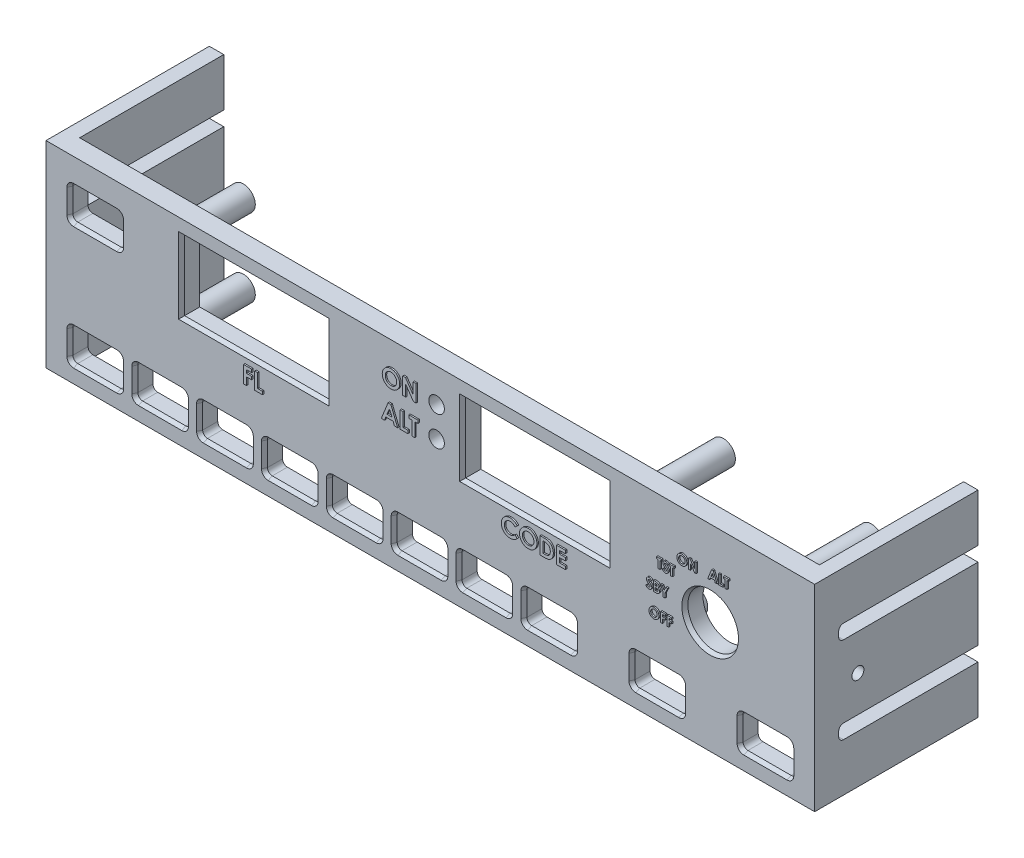
from build123d import *

# Parameters (mm, degrees)
ESQUISSE1_W             = 160
ESQUISSE1_H             = 41
BOSS_EXTRU_1_DEPTH      = 4
ESQUISSE2_R             = 5.5
ESQUISSE2_R_2           = 1.625
ESQUISSE2_W             = 30.5
ESQUISSE2_H             = 15
ENL_V_MAT_EXTRU_1_DEPTH = 4
ESQUISSE4_W             = 3
ESQUISSE4_H             = 41
BOSS_EXTRU_2_DEPTH      = 30
ENL_V_MAT_EXTRU_2_DEPTH = 168.871975029
ESQUISSE7_R             = 2.5
ESQUISSE7_R_2           = 1.25
BOSS_EXTRU_3_DEPTH      = 15
CHANFREIN1_SIZE         = 0.4
CHANFREIN1_SIZE2        = 0.857802768
ESQUISSE9_R             = 1.25
ENL_V_MAT_EXTRU_3_DEPTH = 900
ENL_V_MAT_EXTRU_4_DEPTH = 0.3
BOSS_EXTRU_4_DEPTH      = 0.3
BOSS_EXTRU_4_2_DEPTH    = 0.3
BOSS_EXTRU_4_3_DEPTH    = 0.3
BOSS_EXTRU_4_4_DEPTH    = 0.3
BOSS_EXTRU_4_5_DEPTH    = 0.3
BOSS_EXTRU_4_6_DEPTH    = 0.3
BOSS_EXTRU_4_7_DEPTH    = 0.3
BOSS_EXTRU_4_8_DEPTH    = 0.3
BOSS_EXTRU_4_9_DEPTH    = 0.3
BOSS_EXTRU_4_10_DEPTH   = 0.3
BOSS_EXTRU_4_11_DEPTH   = 0.3
BOSS_EXTRU_4_12_DEPTH   = 0.3
BOSS_EXTRU_4_13_DEPTH   = 0.3
BOSS_EXTRU_4_14_DEPTH   = 0.3
BOSS_EXTRU_4_15_DEPTH   = 0.3
BOSS_EXTRU_4_16_DEPTH   = 0.3
BOSS_EXTRU_4_17_DEPTH   = 0.3
BOSS_EXTRU_4_18_DEPTH   = 0.3
BOSS_EXTRU_4_19_DEPTH   = 0.3
BOSS_EXTRU_4_20_DEPTH   = 0.3
BOSS_EXTRU_4_21_DEPTH   = 0.3
BOSS_EXTRU_4_22_DEPTH   = 0.3
BOSS_EXTRU_4_23_DEPTH   = 0.3
BOSS_EXTRU_4_24_DEPTH   = 0.3
BOSS_EXTRU_4_25_DEPTH   = 0.3


with BuildPart() as part:
    # Esquisse1 → Boss.-Extru.1 (new body)
    with BuildSketch(Plane.XY):
        with Locations((80, 20.5)):
            Rectangle(ESQUISSE1_W, ESQUISSE1_H)
    extrude(amount=BOSS_EXTRU_1_DEPTH)

    # Esquisse2 → Enlèv. mat.-Extru.1 (cut)
    with BuildSketch(Plane.XY.offset(4)):
        with Locations((138.25, 23.25)):
            Circle(ESQUISSE2_R)
        with Locations((81.3, 34.05)):
            Circle(ESQUISSE2_R_2)
        with Locations((81.3, 27.83)):
            Circle(ESQUISSE2_R_2)
        with BuildLine():
            Line((19.25, 10.25), (28.25, 10.25))
            ThreePointArc((28.25, 10.25), (28.957106781, 9.957106781), (29.25, 9.25))
            Line((29.25, 9.25), (29.25, 4.25))
            ThreePointArc((29.25, 4.25), (28.957106781, 3.542893219), (28.25, 3.25))
            Line((28.25, 3.25), (19.25, 3.25))
            ThreePointArc((19.25, 3.25), (18.542893219, 3.542893219), (18.25, 4.25))
            Line((18.25, 4.25), (18.25, 9.25))
            ThreePointArc((18.25, 9.25), (18.542893219, 9.957106781), (19.25, 10.25))
        make_face()
        with BuildLine():
            Line((5.75, 3.25), (14.75, 3.25))
            ThreePointArc((14.75, 3.25), (15.457106781, 3.542893219), (15.75, 4.25))
            Line((15.75, 4.25), (15.75, 9.25))
            ThreePointArc((15.75, 9.25), (15.457106781, 9.957106781), (14.75, 10.25))
            Line((14.75, 10.25), (5.75, 10.25))
            ThreePointArc((5.75, 10.25), (5.042893219, 9.957106781), (4.75, 9.25))
            Line((4.75, 9.25), (4.75, 4.25))
            ThreePointArc((4.75, 4.25), (5.042893219, 3.542893219), (5.75, 3.25))
        make_face()
        with BuildLine():
            Line((32.75, 10.25), (41.75, 10.25))
            ThreePointArc((41.75, 10.25), (42.457106781, 9.957106781), (42.75, 9.25))
            Line((42.75, 9.25), (42.75, 4.25))
            ThreePointArc((42.75, 4.25), (42.457106781, 3.542893219), (41.75, 3.25))
            Line((41.75, 3.25), (32.75, 3.25))
            ThreePointArc((32.75, 3.25), (32.042893219, 3.542893219), (31.75, 4.25))
            Line((31.75, 4.25), (31.75, 9.25))
            ThreePointArc((31.75, 9.25), (32.042893219, 9.957106781), (32.75, 10.25))
        make_face()
        with BuildLine():
            Line((46.25, 10.25), (55.25, 10.25))
            ThreePointArc((55.25, 10.25), (55.957106781, 9.957106781), (56.25, 9.25))
            Line((56.25, 9.25), (56.25, 4.25))
            ThreePointArc((56.25, 4.25), (55.957106781, 3.542893219), (55.25, 3.25))
            Line((55.25, 3.25), (46.25, 3.25))
            ThreePointArc((46.25, 3.25), (45.542893219, 3.542893219), (45.25, 4.25))
            Line((45.25, 4.25), (45.25, 9.25))
            ThreePointArc((45.25, 9.25), (45.542893219, 9.957106781), (46.25, 10.25))
        make_face()
        with BuildLine():
            Line((59.75, 10.25), (68.75, 10.25))
            ThreePointArc((68.75, 10.25), (69.457106781, 9.957106781), (69.75, 9.25))
            Line((69.75, 9.25), (69.75, 4.25))
            ThreePointArc((69.75, 4.25), (69.457106781, 3.542893219), (68.75, 3.25))
            Line((68.75, 3.25), (59.75, 3.25))
            ThreePointArc((59.75, 3.25), (59.042893219, 3.542893219), (58.75, 4.25))
            Line((58.75, 4.25), (58.75, 9.25))
            ThreePointArc((58.75, 9.25), (59.042893219, 9.957106781), (59.75, 10.25))
        make_face()
        with BuildLine():
            Line((73.25, 10.25), (82.25, 10.25))
            ThreePointArc((82.25, 10.25), (82.957106781, 9.957106781), (83.25, 9.25))
            Line((83.25, 9.25), (83.25, 4.25))
            ThreePointArc((83.25, 4.25), (82.957106781, 3.542893219), (82.25, 3.25))
            Line((82.25, 3.25), (73.25, 3.25))
            ThreePointArc((73.25, 3.25), (72.542893219, 3.542893219), (72.25, 4.25))
            Line((72.25, 4.25), (72.25, 9.25))
            ThreePointArc((72.25, 9.25), (72.542893219, 9.957106781), (73.25, 10.25))
        make_face()
        with BuildLine():
            Line((86.75, 10.25), (95.75, 10.25))
            ThreePointArc((95.75, 10.25), (96.457106781, 9.957106781), (96.75, 9.25))
            Line((96.75, 9.25), (96.75, 4.25))
            ThreePointArc((96.75, 4.25), (96.457106781, 3.542893219), (95.75, 3.25))
            Line((95.75, 3.25), (86.75, 3.25))
            ThreePointArc((86.75, 3.25), (86.042893219, 3.542893219), (85.75, 4.25))
            Line((85.75, 4.25), (85.75, 9.25))
            ThreePointArc((85.75, 9.25), (86.042893219, 9.957106781), (86.75, 10.25))
        make_face()
        with BuildLine():
            Line((100.25, 10.25), (109.25, 10.25))
            ThreePointArc((109.25, 10.25), (109.957106781, 9.957106781), (110.25, 9.25))
            Line((110.25, 9.25), (110.25, 4.25))
            ThreePointArc((110.25, 4.25), (109.957106781, 3.542893219), (109.25, 3.25))
            Line((109.25, 3.25), (100.25, 3.25))
            ThreePointArc((100.25, 3.25), (99.542893219, 3.542893219), (99.25, 4.25))
            Line((99.25, 4.25), (99.25, 9.25))
            ThreePointArc((99.25, 9.25), (99.542893219, 9.957106781), (100.25, 10.25))
        make_face()
        with BuildLine():
            Line((122.75, 3.25), (131.75, 3.25))
            ThreePointArc((131.75, 3.25), (132.457106781, 3.542893219), (132.75, 4.25))
            Line((132.75, 4.25), (132.75, 9.25))
            ThreePointArc((132.75, 9.25), (132.457106781, 9.957106781), (131.75, 10.25))
            Line((131.75, 10.25), (122.75, 10.25))
            ThreePointArc((122.75, 10.25), (122.042893219, 9.957106781), (121.75, 9.25))
            Line((121.75, 9.25), (121.75, 4.25))
            ThreePointArc((121.75, 4.25), (122.042893219, 3.542893219), (122.75, 3.25))
        make_face()
        with BuildLine():
            Line((145.25, 3.25), (154.25, 3.25))
            ThreePointArc((154.25, 3.25), (154.957106781, 3.542893219), (155.25, 4.25))
            Line((155.25, 4.25), (155.25, 9.25))
            ThreePointArc((155.25, 9.25), (154.957106781, 9.957106781), (154.25, 10.25))
            Line((154.25, 10.25), (145.25, 10.25))
            ThreePointArc((145.25, 10.25), (144.542893219, 9.957106781), (144.25, 9.25))
            Line((144.25, 9.25), (144.25, 4.25))
            ThreePointArc((144.25, 4.25), (144.542893219, 3.542893219), (145.25, 3.25))
        make_face()
        with BuildLine():
            Line((5.75, 35.75), (14.75, 35.75))
            ThreePointArc((14.75, 35.75), (15.457106781, 35.457106781), (15.75, 34.75))
            Line((15.75, 34.75), (15.75, 29.75))
            ThreePointArc((15.75, 29.75), (15.457106781, 29.042893219), (14.75, 28.75))
            Line((14.75, 28.75), (5.75, 28.75))
            ThreePointArc((5.75, 28.75), (5.042893219, 29.042893219), (4.75, 29.75))
            Line((4.75, 29.75), (4.75, 34.75))
            ThreePointArc((4.75, 34.75), (5.042893219, 35.457106781), (5.75, 35.75))
        make_face()
        with Locations((43.25, 30.5)):
            Rectangle(ESQUISSE2_W, ESQUISSE2_H)
        with Locations((101.75, 30.5)):
            Rectangle(ESQUISSE2_W, ESQUISSE2_H)
    extrude(amount=-ENL_V_MAT_EXTRU_1_DEPTH, mode=Mode.SUBTRACT)

    # Esquisse4 → Boss.-Extru.2 (add)
    with BuildSketch(Plane(origin=(0, 0, 0), x_dir=(-1, 0, 0), z_dir=(0, 0, -1))):
        with Locations((-158.5, 20.5)):
            Rectangle(ESQUISSE4_W, ESQUISSE4_H)
        with Locations((-1.5, 20.5)):
            Rectangle(ESQUISSE4_W, ESQUISSE4_H)
    extrude(amount=BOSS_EXTRU_2_DEPTH)

    # Esquisse5 → Enlèv. mat.-Extru.2 (cut, through all)
    with BuildSketch(Plane(origin=(160, 0, 0), x_dir=(0, 0, -1), z_dir=(1, 0, 0))):
        with BuildLine():
            Line((30, 13), (2, 13))
            ThreePointArc((2, 13), (1.292893219, 12.707106781), (1, 12))
            Line((1, 12), (1, 11))
            ThreePointArc((1, 11), (1.292893219, 10.292893219), (2, 10))
            Line((2, 10), (30, 10))
            Line((30, 10), (30, 13))
        make_face()
        with BuildLine():
            Line((30, 31), (2, 31))
            ThreePointArc((2, 31), (1.292893219, 30.707106781), (1, 30))
            Line((1, 30), (1, 29))
            ThreePointArc((1, 29), (1.292893219, 28.292893219), (2, 28))
            Line((2, 28), (30, 28))
            Line((30, 28), (30, 31))
        make_face()
    extrude(amount=-ENL_V_MAT_EXTRU_2_DEPTH, mode=Mode.SUBTRACT)

    # Esquisse7 → Boss.-Extru.3 (add)
    # profile 1 of 7: a face of its own
    with BuildSketch(Plane(origin=(0, 0, 0), x_dir=(-1, 0, 0), z_dir=(0, 0, -1))):
        with Locations((-22.066417501, 32.220467417)):
            Circle(ESQUISSE7_R)
        with Locations((-22.066417501, 32.220467417)):
            Circle(ESQUISSE7_R_2, mode=Mode.SUBTRACT)
    # profile 2 of 7: a face of its own
    with BuildSketch(Plane(origin=(0, 0, 0), x_dir=(-1, 0, 0), z_dir=(0, 0, -1))):
        with Locations((-22.066417501, 15.960655172)):
            Circle(ESQUISSE7_R)
        with Locations((-22.066417501, 15.960655172)):
            Circle(ESQUISSE7_R_2, mode=Mode.SUBTRACT)
    # profile 3 of 7: a face of its own
    with BuildSketch(Plane(origin=(0, 0, 0), x_dir=(-1, 0, 0), z_dir=(0, 0, -1))):
        with Locations((-152.81245368, 36.297265299)):
            Circle(ESQUISSE7_R)
        with Locations((-152.81245368, 36.297265299)):
            Circle(ESQUISSE7_R_2, mode=Mode.SUBTRACT)
    # profile 4 of 7: a face of its own
    with BuildSketch(Plane(origin=(0, 0, 0), x_dir=(-1, 0, 0), z_dir=(0, 0, -1))):
        with Locations((-152.81245368, 14.495559759)):
            Circle(ESQUISSE7_R)
        with Locations((-152.81245368, 14.495559759)):
            Circle(ESQUISSE7_R_2, mode=Mode.SUBTRACT)
    # profile 5 of 7: a face of its own
    with BuildSketch(Plane(origin=(0, 0, 0), x_dir=(-1, 0, 0), z_dir=(0, 0, -1))):
        with Locations((-122, 36.297265299)):
            Circle(ESQUISSE7_R)
        with Locations((-122, 36.297265299)):
            Circle(ESQUISSE7_R_2, mode=Mode.SUBTRACT)
    # profile 6 of 7: a face of its own
    with BuildSketch(Plane(origin=(0, 0, 0), x_dir=(-1, 0, 0), z_dir=(0, 0, -1))):
        with Locations((-116.25, 6.75)):
            Circle(ESQUISSE7_R)
        with Locations((-116.25, 6.75)):
            Circle(ESQUISSE7_R_2, mode=Mode.SUBTRACT)
    # profile 7 of 7: a face of its own
    with BuildSketch(Plane(origin=(0, 0, 0), x_dir=(-1, 0, 0), z_dir=(0, 0, -1))):
        with Locations((-63.5, 14.495559759)):
            Circle(ESQUISSE7_R)
        with Locations((-63.5, 14.495559759)):
            Circle(ESQUISSE7_R_2, mode=Mode.SUBTRACT)
    extrude(amount=BOSS_EXTRU_3_DEPTH)

    # Chanfrein1
    chanfrein1_edges = [part.edges().sort_by_distance(p)[0] for p in [
        (101.75, 38, 4),
        (117, 30.5, 4),
        (101.75, 23, 4),
        (86.5, 30.5, 4),
        (58.5, 30.5, 4),
        (43.25, 23, 4),
        (28, 30.5, 4),
        (43.25, 38, 4),
        (132.75, 23.25, 4),
        (149.75, 3.25, 4),
        (154.957106781, 3.542893219, 4),
        (144.542893219, 3.542893219, 4),
        (155.25, 6.75, 4),
        (144.25, 6.75, 4),
        (154.957106781, 9.957106781, 4),
        (144.542893219, 9.957106781, 4),
        (149.75, 10.25, 4),
        (127.25, 3.25, 4),
        (132.457106781, 3.542893219, 4),
        (122.042893219, 3.542893219, 4),
        (132.75, 6.75, 4),
        (121.75, 6.75, 4),
        (132.457106781, 9.957106781, 4),
        (122.042893219, 9.957106781, 4),
        (127.25, 10.25, 4),
        (104.75, 3.25, 4),
        (109.957106781, 3.542893219, 4),
        (99.542893219, 3.542893219, 4),
        (110.25, 6.75, 4),
        (99.25, 6.75, 4),
        (109.957106781, 9.957106781, 4),
        (99.542893219, 9.957106781, 4),
        (104.75, 10.25, 4),
        (91.25, 3.25, 4),
        (96.457106781, 3.542893219, 4),
        (86.042893219, 3.542893219, 4),
        (96.75, 6.75, 4),
        (85.75, 6.75, 4),
        (96.457106781, 9.957106781, 4),
        (86.042893219, 9.957106781, 4),
        (91.25, 10.25, 4),
        (77.75, 3.25, 4),
        (82.957106781, 3.542893219, 4),
        (72.542893219, 3.542893219, 4),
        (83.25, 6.75, 4),
        (72.25, 6.75, 4),
        (82.957106781, 9.957106781, 4),
        (72.542893219, 9.957106781, 4),
        (77.75, 10.25, 4),
        (64.25, 3.25, 4),
        (69.457106781, 3.542893219, 4),
        (59.042893219, 3.542893219, 4),
        (69.75, 6.75, 4),
        (58.75, 6.75, 4),
        (69.457106781, 9.957106781, 4),
        (59.042893219, 9.957106781, 4),
        (64.25, 10.25, 4),
        (50.75, 3.25, 4),
        (55.957106781, 3.542893219, 4),
        (45.542893219, 3.542893219, 4),
        (56.25, 6.75, 4),
        (45.25, 6.75, 4),
        (55.957106781, 9.957106781, 4),
        (45.542893219, 9.957106781, 4),
        (50.75, 10.25, 4),
        (37.25, 3.25, 4),
        (42.457106781, 3.542893219, 4),
        (32.042893219, 3.542893219, 4),
        (42.75, 6.75, 4),
        (31.75, 6.75, 4),
        (42.457106781, 9.957106781, 4),
        (32.042893219, 9.957106781, 4),
        (37.25, 10.25, 4),
        (23.75, 3.25, 4),
        (28.957106781, 3.542893219, 4),
        (18.542893219, 3.542893219, 4),
        (29.25, 6.75, 4),
        (18.25, 6.75, 4),
        (28.957106781, 9.957106781, 4),
        (18.542893219, 9.957106781, 4),
        (23.75, 10.25, 4),
        (10.25, 3.25, 4),
        (15.457106781, 3.542893219, 4),
        (5.042893219, 3.542893219, 4),
        (15.75, 6.75, 4),
        (4.75, 6.75, 4),
        (15.457106781, 9.957106781, 4),
        (5.042893219, 9.957106781, 4),
        (10.25, 10.25, 4),
        (10.25, 35.75, 4),
        (5.042893219, 35.457106781, 4),
        (15.457106781, 35.457106781, 4),
        (4.75, 32.25, 4),
        (15.75, 32.25, 4),
        (5.042893219, 29.042893219, 4),
        (15.457106781, 29.042893219, 4),
        (10.25, 28.75, 4),
    ]]
    chanfrein1_side = [part.faces().sort_by_distance(p)[0] for p in [
        (82.430470131, 20.497923343, 4),
    ]]
    chamfer(chanfrein1_edges, length=CHANFREIN1_SIZE, length2=CHANFREIN1_SIZE2, reference=chanfrein1_side[0])

    # Esquisse9 → Enlèv. mat.-Extru.3 (cut)
    with BuildSketch(Plane(origin=(160, 0, 0), x_dir=(0, 0, -1), z_dir=(1, 0, 0))):
        with Locations((5, 20.5)):
            Circle(ESQUISSE9_R)
    extrude(amount=-ENL_V_MAT_EXTRU_3_DEPTH, mode=Mode.SUBTRACT)

    # Esquisse8 → Enlèv. mat.-Extru.4 (cut)
    # profile 1 of 25: a face of its own
    with BuildSketch(Plane.XY.offset(4)):
        Polygon((129.575536536, 20.385193728), (130.549895511, 20.385193728), (130.549895511, 20.026219369), (129.934510895, 20.026219369), (129.934510895, 19.641603984), (130.549895511, 19.641603984), (130.549895511, 19.282629625), (129.934510895, 19.282629625), (129.934510895, 18.385193728), (129.575536536, 18.385193728), align=None)
    # profile 2 of 25: a face of its own
    with BuildSketch(Plane.XY.offset(4)):
        Polygon((128.242203203, 20.385193728), (129.216562177, 20.385193728), (129.216562177, 20.026219369), (128.601177562, 20.026219369), (128.601177562, 19.641603984), (129.216562177, 19.641603984), (129.216562177, 19.282629625), (128.601177562, 19.282629625), (128.601177562, 18.385193728), (128.242203203, 18.385193728), align=None)
    # profile 3 of 25: a face of its own
    with BuildSketch(Plane.XY.offset(4)):
        with BuildLine():
            add(Edge.make_bspline(
                [(126.848773716, 20.436475779), (126.883546167, 20.435575458), (126.952194861, 20.433798021), (127.053152318, 20.418981691), (127.150443494, 20.394840605), (127.244024396, 20.36128275), (127.333660706, 20.317399209), (127.419668603, 20.264434108), (127.501740011, 20.201387763), (127.579033926, 20.129730941), (127.650467445, 20.051807276), (127.71236463, 19.967908597), (127.765148279, 19.880208803), (127.808895508, 19.7884729), (127.842217166, 19.692065573), (127.865600352, 19.591478371), (127.88062289, 19.486739912), (127.882350713, 19.415427297), (127.883228844, 19.379184112)],
                knots=[0, 0, 0, 0, 1.014329547, 2.002516266, 2.970391464, 3.935626869, 4.897733899, 5.877609409, 6.878433252, 7.912639331, 8.949961323, 9.958554974, 10.949718813, 11.932905612, 12.9188844, 13.919928257, 14.942845884, 16, 16, 16, 16], degree=3))
            add(Edge.make_bspline(
                [(127.883228844, 19.379184112), (127.882293673, 19.343349305), (127.880450887, 19.272735667), (127.866213638, 19.168962413), (127.842436676, 19.06945271), (127.80968018, 18.973981315), (127.76672636, 18.883010659), (127.714972049, 18.795959906), (127.653051551, 18.713636909), (127.583223349, 18.636085844), (127.506348557, 18.565691613), (127.42492595, 18.503656818), (127.339331485, 18.451090873), (127.249690447, 18.408017858), (127.155810603, 18.374590476), (127.057923849, 18.35100503), (126.956036242, 18.336671678), (126.886747728, 18.334840929), (126.851578203, 18.333911677)],
                knots=[0, 0, 0, 0, 1.051557043, 2.072126891, 3.067553643, 4.050577992, 5.02905126, 6.015227836, 7.017913613, 8.04756643, 9.074058332, 10.072836633, 11.047628519, 12.017157415, 12.98668631, 13.966869689, 14.968021931, 16, 16, 16, 16], degree=3))
            add(Edge.make_bspline(
                [(126.851578203, 18.333911677), (126.814795097, 18.334745262), (126.742521322, 18.336383144), (126.636748328, 18.351958652), (126.535408661, 18.375420808), (126.439353631, 18.410436818), (126.347605001, 18.454209774), (126.260836874, 18.508118794), (126.17907841, 18.572074789), (126.10279859, 18.644439823), (126.033688888, 18.723623041), (125.97268602, 18.807273089), (125.921228748, 18.894750955), (125.879315189, 18.986097579), (125.846272222, 19.080745264), (125.822964163, 19.179270443), (125.809195537, 19.281436817), (125.807277647, 19.35083026), (125.806305767, 19.38599501)],
                knots=[0, 0, 0, 0, 1.067978421, 2.098431617, 3.099715153, 4.085208694, 5.062210972, 6.048429807, 7.046490867, 8.072918869, 9.098532598, 10.095778865, 11.076610158, 12.041847152, 13.011192615, 13.984257998, 14.978533688, 16, 16, 16, 16], degree=3))
            add(Edge.make_bspline(
                [(125.806305767, 19.38599501), (125.806610799, 19.409652013), (125.807217001, 19.456666467), (125.814519337, 19.526339489), (125.825032603, 19.594652587), (125.840581223, 19.661333395), (125.859468823, 19.726852317), (125.883940376, 19.790599485), (125.911795627, 19.853255894), (125.944341864, 19.914081495), (125.980530134, 19.972516641), (126.020014757, 20.028285682), (126.062895019, 20.08071429), (126.109032787, 20.130147004), (126.158587059, 20.176258898), (126.210905999, 20.219702752), (126.26700429, 20.259324542), (126.325654116, 20.296091911), (126.386524823, 20.329340005), (126.449368613, 20.357639788), (126.512890779, 20.382353507), (126.577939891, 20.401858666), (126.643818832, 20.417745415), (126.711231386, 20.428251594), (126.779568519, 20.435553728), (126.825650571, 20.436167699), (126.848773716, 20.436475779)],
                knots=[0, 0, 0, 0, 1.034744296, 2.056386356, 3.06226378, 4.057406941, 5.050368692, 6.043467995, 7.042652155, 8.049140477, 9.059438543, 10.048523776, 11.036952808, 12.020949711, 13.004946614, 13.997082645, 14.994316842, 16.007702937, 17.024872941, 18.026463647, 19.021641123, 20.005082605, 20.995858141, 21.984425357, 22.988620895, 24, 24, 24, 24], degree=3))
        make_face()
        with BuildLine():
            add(Edge.make_bspline(
                [(126.843164741, 20.07750142), (126.819762886, 20.076873496), (126.773576989, 20.075634225), (126.705830689, 20.066192653), (126.640791849, 20.051113391), (126.578821004, 20.029271263), (126.519649567, 20.001471778), (126.463172647, 19.967812071), (126.410172331, 19.927135126), (126.359941911, 19.881624708), (126.314566993, 19.830915643), (126.274476821, 19.776572257), (126.240927804, 19.7186853), (126.212830292, 19.65779253), (126.191679093, 19.593209224), (126.176613728, 19.525441269), (126.16709298, 19.454371898), (126.165892878, 19.405924001), (126.165280126, 19.381187318)],
                knots=[0, 0, 0, 0, 1.033739768, 2.040188636, 3.016340934, 3.979330865, 4.937572243, 5.900995986, 6.878200029, 7.884839167, 8.891893314, 9.879764717, 10.863503415, 11.843163062, 12.837761627, 13.859916423, 14.907309254, 16, 16, 16, 16], degree=3))
            add(Edge.make_bspline(
                [(126.165280126, 19.381187318), (126.166092542, 19.353773508), (126.167684742, 19.300046984), (126.178887654, 19.221672178), (126.198054723, 19.147654953), (126.225731597, 19.078357315), (126.260058183, 19.013009767), (126.302686354, 18.952413234), (126.352925736, 18.896204895), (126.391629749, 18.863388125), (126.411273716, 18.846732189)],
                knots=[0, 0, 0, 0, 1.078454662, 2.113592447, 3.107694534, 4.079536787, 5.043276885, 6.005368276, 6.987637804, 8, 8, 8, 8], degree=3))
            add(Edge.make_bspline(
                [(126.411273716, 18.846732189), (126.427365875, 18.834427424), (126.459187634, 18.810095122), (126.50998209, 18.778908285), (126.562290378, 18.752178054), (126.616507229, 18.730580344), (126.67251814, 18.713591948), (126.730315431, 18.701695254), (126.789817207, 18.69422905), (126.830055096, 18.693336697), (126.85037628, 18.692886036)],
                knots=[0, 0, 0, 0, 1.023928204, 2.024787132, 3.009472467, 3.9914905, 4.972207045, 5.96565515, 6.972602802, 8, 8, 8, 8], degree=3))
            add(Edge.make_bspline(
                [(126.85037628, 18.692886036), (126.873375739, 18.693519284), (126.918627899, 18.69476522), (126.985113065, 18.704090561), (127.048807874, 18.719872403), (127.110107747, 18.741522924), (127.168835925, 18.769671456), (127.224705385, 18.804375181), (127.277814082, 18.845207985), (127.327980509, 18.891316054), (127.373834994, 18.942224878), (127.413841507, 18.996858127), (127.448457214, 19.054012067), (127.475970438, 19.114495626), (127.497957273, 19.177737868), (127.512841318, 19.244018878), (127.522442495, 19.313065421), (127.523642936, 19.360054034), (127.524254485, 19.383991805)],
                knots=[0, 0, 0, 0, 1.026359118, 2.019393844, 2.989460624, 3.950973911, 4.916101784, 5.890408035, 6.881132271, 7.902007068, 8.92769091, 9.933912415, 10.920395702, 11.90457117, 12.894218921, 13.903490204, 14.931958862, 16, 16, 16, 16], degree=3))
            add(Edge.make_bspline(
                [(127.524254485, 19.383991805), (127.523621776, 19.407791927), (127.522376384, 19.454638838), (127.513034631, 19.523507863), (127.497352872, 19.589496262), (127.475637337, 19.652711801), (127.447907749, 19.713216454), (127.4136173, 19.770797452), (127.372886311, 19.825399127), (127.326652204, 19.876649391), (127.27632922, 19.9237451), (127.222302468, 19.964615615), (127.166083678, 20.000130792), (127.106382916, 20.027951949), (127.044421611, 20.050117005), (126.979821669, 20.06643967), (126.912338416, 20.075567897), (126.866428164, 20.076851168), (126.843164741, 20.07750142)],
                knots=[0, 0, 0, 0, 1.055025985, 2.07665775, 3.074803781, 4.057872707, 5.035505728, 6.020516407, 7.023567878, 8.050795229, 9.077271434, 10.074415901, 11.050397877, 12.019801805, 12.988065821, 13.964604439, 14.968634123, 16, 16, 16, 16], degree=3))
        make_face(mode=Mode.SUBTRACT)
    # profile 4 of 25: a face of its own
    with BuildSketch(Plane.XY.offset(4)):
        with BuildLine():
            Line((126.343168247, 24.982772436), (126.07473876, 24.737179487))
            add(Edge.make_bspline(
                [(126.07473876, 24.737179487), (126.063240392, 24.753399131), (126.041165128, 24.784538585), (126.005383429, 24.826235048), (125.969763302, 24.861805234), (125.933974749, 24.891100547), (125.897700554, 24.913942997), (125.861003683, 24.930115703), (125.824092181, 24.940396846), (125.79929335, 24.941677096), (125.787078504, 24.942307692)],
                knots=[0, 0, 0, 0, 1.299362458, 2.494594718, 3.587462134, 4.587049575, 5.512617175, 6.380583204, 7.202344345, 8, 8, 8, 8], degree=3))
            add(Edge.make_bspline(
                [(125.787078504, 24.942307692), (125.775684845, 24.941908118), (125.753686684, 24.941136644), (125.722326673, 24.93346825), (125.694484808, 24.920233729), (125.670188263, 24.902928479), (125.650941815, 24.882079664), (125.635575018, 24.860214619), (125.62692222, 24.836080553), (125.625783342, 24.819504304), (125.625219529, 24.811298077)],
                knots=[0, 0, 0, 0, 1.185010067, 2.2879431, 3.333075148, 4.379039566, 5.372662701, 6.27520591, 7.14612461, 8, 8, 8, 8], degree=3))
            add(Edge.make_bspline(
                [(125.625219529, 24.811298077), (125.625572842, 24.802973513), (125.626284365, 24.786208997), (125.633156704, 24.761638511), (125.643515282, 24.737630287), (125.653413325, 24.723015338), (125.658472734, 24.715544872)],
                knots=[0, 0, 0, 0, 0.967525499, 1.948461899, 2.951351359, 4, 4, 4, 4], degree=3))
            add(Edge.make_bspline(
                [(125.658472734, 24.715544872), (125.663072285, 24.709738157), (125.673659841, 24.696371865), (125.693848144, 24.675201743), (125.719200412, 24.64926649), (125.750692254, 24.619457943), (125.787016357, 24.584704072), (125.82985639, 24.546371064), (125.877979231, 24.503271789), (125.912183831, 24.473259015), (125.93010735, 24.457532051)],
                knots=[0, 0, 0, 0, 0.473873513, 1.090794244, 1.870441696, 2.795289791, 3.865433203, 5.087734844, 6.473946851, 8, 8, 8, 8], degree=3))
            add(Edge.make_bspline(
                [(125.93010735, 24.457532051), (125.94693115, 24.442971901), (125.978859228, 24.41533976), (126.024286542, 24.376120373), (126.064209585, 24.340835647), (126.099209945, 24.310015129), (126.128757051, 24.283335443), (126.152975118, 24.26066906), (126.172159929, 24.242457252), (126.183065371, 24.231457309), (126.187719529, 24.226762821)],
                knots=[0, 0, 0, 0, 1.543621617, 2.929473131, 4.163658386, 5.240097082, 6.164993805, 6.925417477, 7.541396219, 8, 8, 8, 8], degree=3))
            add(Edge.make_bspline(
                [(126.187719529, 24.226762821), (126.205376435, 24.207654267), (126.239319208, 24.170920917), (126.283432847, 24.113995777), (126.319739799, 24.058425234), (126.347827546, 24.003163636), (126.369040542, 23.94741367), (126.383995985, 23.88980807), (126.392952899, 23.829744893), (126.393947326, 23.788759108), (126.394450299, 23.768028846)],
                knots=[0, 0, 0, 0, 1.206664779, 2.319633467, 3.337109185, 4.282041471, 5.190008762, 6.099243693, 7.03861361, 8, 8, 8, 8], degree=3))
            add(Edge.make_bspline(
                [(126.394450299, 23.768028846), (126.394092296, 23.747829748), (126.39338988, 23.708198366), (126.384786642, 23.650203742), (126.372518928, 23.59470037), (126.353550891, 23.542292204), (126.33043276, 23.492118982), (126.301450844, 23.444962242), (126.267415557, 23.400344738), (126.228405893, 23.359064064), (126.185256571, 23.321604713), (126.138974824, 23.288257514), (126.089108083, 23.260725154), (126.036082403, 23.238054219), (125.979926168, 23.220592762), (125.920706275, 23.207687118), (125.858332145, 23.199941354), (125.815679816, 23.199131626), (125.793889401, 23.198717949)],
                knots=[0, 0, 0, 0, 1.043214005, 2.046824704, 3.02475056, 3.976699089, 4.921714032, 5.875962561, 6.831408892, 7.817874052, 8.806269674, 9.781291748, 10.760897367, 11.74438705, 12.757449933, 13.795994037, 14.874007457, 16, 16, 16, 16], degree=3))
            add(Edge.make_bspline(
                [(125.793889401, 23.198717949), (125.776784111, 23.199021408), (125.742905827, 23.199622431), (125.692974357, 23.204529287), (125.644759879, 23.212448429), (125.598316701, 23.223798925), (125.55343559, 23.238181544), (125.510114701, 23.255749362), (125.468653092, 23.276774673), (125.428737047, 23.300825114), (125.390560607, 23.328750844), (125.353641044, 23.359980931), (125.318345079, 23.394995707), (125.284503193, 23.433712363), (125.252331916, 23.476240537), (125.220778167, 23.521987944), (125.191244288, 23.571803594), (125.172999898, 23.606749676), (125.163681068, 23.624599359)],
                knots=[0, 0, 0, 0, 1.016823716, 2.013894106, 2.979844003, 3.91962641, 4.853723003, 5.779685073, 6.695824784, 7.614987388, 8.547259901, 9.504950863, 10.487499108, 11.500346958, 12.559593716, 13.656357062, 14.802919212, 16, 16, 16, 16], degree=3))
            Line((125.163681068, 23.624599359), (125.479386196, 23.814102564))
            add(Edge.make_bspline(
                [(125.479386196, 23.814102564), (125.491042659, 23.793840842), (125.513389095, 23.754997389), (125.551257221, 23.702806287), (125.590051182, 23.658113247), (125.63066786, 23.621708221), (125.672613373, 23.593104429), (125.716090326, 23.572662175), (125.761129265, 23.560008442), (125.791807744, 23.558463129), (125.807110555, 23.557692308)],
                knots=[0, 0, 0, 0, 1.283663364, 2.460892379, 3.537111102, 4.529833553, 5.449777664, 6.316464042, 7.160231139, 8, 8, 8, 8], degree=3))
            add(Edge.make_bspline(
                [(125.807110555, 23.557692308), (125.822675704, 23.558321802), (125.85287436, 23.559543114), (125.895979078, 23.570823998), (125.935499115, 23.588535813), (125.969659943, 23.613808132), (125.998585178, 23.642976228), (126.019933662, 23.675427069), (126.033344924, 23.710538096), (126.034762819, 23.734928525), (126.03547594, 23.747195513)],
                knots=[0, 0, 0, 0, 1.13588714, 2.203786484, 3.234766741, 4.283437687, 5.291419208, 6.222934724, 7.106237994, 8, 8, 8, 8], degree=3))
            add(Edge.make_bspline(
                [(126.03547594, 23.747195513), (126.034817402, 23.758607949), (126.033479647, 23.781791221), (126.023626152, 23.816261017), (126.008222134, 23.850715138), (125.989998095, 23.87897534), (125.971452853, 23.902636841), (125.953719419, 23.923138461), (125.932124787, 23.945789163), (125.906723712, 23.970617438), (125.877851809, 23.997841856), (125.845484756, 24.027459752), (125.809251916, 24.059210227), (125.783642474, 24.080838337), (125.770251581, 24.092147436)],
                knots=[0, 0, 0, 0, 0.916159276, 1.861089862, 2.860218735, 3.940849679, 4.552606315, 5.27541173, 6.11797699, 7.06649574, 8.129236253, 9.306560635, 10.591630461, 12, 12, 12, 12], degree=3))
            add(Edge.make_bspline(
                [(125.770251581, 24.092147436), (125.74479496, 24.113686178), (125.695935999, 24.155025544), (125.626892089, 24.216082486), (125.564677344, 24.273145792), (125.509829118, 24.326920891), (125.461648558, 24.376414681), (125.420461965, 24.422029169), (125.386721793, 24.464116208), (125.351217536, 24.513965489), (125.317481394, 24.574710264), (125.288323794, 24.64779327), (125.269407573, 24.720867003), (125.267288274, 24.769924682), (125.26624517, 24.794070513)],
                knots=[0, 0, 0, 0, 1.345494975, 2.582412109, 3.71882943, 4.751509156, 5.681369928, 6.505683931, 7.230279997, 7.856715994, 8.973648664, 10.023341002, 11.027102913, 12, 12, 12, 12], degree=3))
            add(Edge.make_bspline(
                [(125.26624517, 24.794070513), (125.266678996, 24.81119344), (125.267533678, 24.844927446), (125.27515758, 24.894528386), (125.286551791, 24.942389125), (125.303099456, 24.988335047), (125.324576328, 25.0323086), (125.350659155, 25.074525056), (125.381752953, 25.114595862), (125.416793564, 25.152494455), (125.455399347, 25.187129457), (125.496654532, 25.217698316), (125.54032561, 25.243517218), (125.586145426, 25.264935873), (125.634397904, 25.281330493), (125.684727572, 25.292951816), (125.737206618, 25.299863809), (125.772901732, 25.300803414), (125.791084914, 25.301282051)],
                knots=[0, 0, 0, 0, 1.010766082, 1.991317756, 2.957454644, 3.913069143, 4.869106762, 5.843196583, 6.838735724, 7.860187025, 8.887984031, 9.89767229, 10.887916223, 11.879572884, 12.879850636, 13.892031539, 14.926195476, 16, 16, 16, 16], degree=3))
            add(Edge.make_bspline(
                [(125.791084914, 25.301282051), (125.814649418, 25.300420012), (125.861592417, 25.298702737), (125.930998995, 25.285274208), (125.998792438, 25.264156432), (126.053421665, 25.238680159), (126.096889121, 25.214001281), (126.130202866, 25.191280079), (126.164101394, 25.165251721), (126.198858077, 25.135834185), (126.233827081, 25.102473205), (126.270002742, 25.065962967), (126.306892123, 25.025987936), (126.330864372, 24.997429959), (126.343168247, 24.982772436)],
                knots=[0, 0, 0, 0, 1.282922637, 2.555718331, 3.837320111, 5.142675274, 5.830281639, 6.55870424, 7.337177975, 8.157850921, 9.037902056, 9.96903443, 10.957596896, 12, 12, 12, 12], degree=3))
        make_face()
    # profile 5 of 25: a face of its own
    with BuildSketch(Plane.XY.offset(4)):
        with BuildLine():
            Line((126.753424658, 23.25), (126.753424658, 25.25))
            Line((126.753424658, 25.25), (127.073937478, 25.25))
            add(Edge.make_bspline(
                [(127.073937478, 25.25), (127.09637538, 25.250002561), (127.139792294, 25.250007516), (127.20243157, 25.24780783), (127.260524208, 25.24496229), (127.313885336, 25.241778793), (127.362605777, 25.23629299), (127.406611445, 25.230511554), (127.445990262, 25.223539498), (127.470336044, 25.217285348), (127.481790042, 25.214342949)],
                knots=[0, 0, 0, 0, 1.311965854, 2.538629056, 3.664479157, 4.713267157, 5.663616078, 6.530575999, 7.308677837, 8, 8, 8, 8], degree=3))
            add(Edge.make_bspline(
                [(127.481790042, 25.214342949), (127.496830304, 25.210192642), (127.526344126, 25.202048407), (127.568617338, 25.185600773), (127.608719377, 25.167318062), (127.646601278, 25.146460908), (127.682030432, 25.122777506), (127.714872197, 25.096079899), (127.745834886, 25.067439727), (127.773819088, 25.036058797), (127.799112195, 25.002899031), (127.82108737, 24.967969118), (127.840180981, 24.931803159), (127.85546087, 24.893946031), (127.86697398, 24.854572074), (127.875394621, 24.813849423), (127.880852336, 24.77164922), (127.881368019, 24.742939043), (127.881629786, 24.728365385)],
                knots=[0, 0, 0, 0, 1.099996261, 2.158545794, 3.195537121, 4.207578794, 5.205712374, 6.197378256, 7.190519799, 8.17788031, 9.159561366, 10.129234751, 11.085776129, 12.040971148, 13.00380137, 13.975669004, 14.972423361, 16, 16, 16, 16], degree=3))
            add(Edge.make_bspline(
                [(127.881629786, 24.728365385), (127.880945342, 24.709642059), (127.8795981, 24.672787494), (127.870991823, 24.618654806), (127.854853714, 24.567491635), (127.83373739, 24.518355063), (127.805025791, 24.47142837), (127.768567613, 24.426733869), (127.72495336, 24.382895348), (127.69149882, 24.356617112), (127.674097734, 24.342948718)],
                knots=[0, 0, 0, 0, 0.986156485, 1.941127874, 2.875419072, 3.804401753, 4.751181392, 5.761612777, 6.835722519, 8, 8, 8, 8], degree=3))
            add(Edge.make_bspline(
                [(127.674097734, 24.342948718), (127.688198739, 24.335750277), (127.715846909, 24.321636127), (127.755099187, 24.298436676), (127.791442511, 24.273761118), (127.825039835, 24.248105935), (127.855186416, 24.220383566), (127.883127056, 24.192191413), (127.90748331, 24.161914182), (127.929263407, 24.130631011), (127.948194312, 24.097888916), (127.964681044, 24.063743192), (127.978606794, 24.028077189), (127.99039948, 23.991072419), (127.999194469, 23.952601601), (128.004928988, 23.912650978), (128.009319694, 23.871356802), (128.00966125, 23.84322824), (128.009834914, 23.828926282)],
                knots=[0, 0, 0, 0, 1.164658916, 2.283573913, 3.35186032, 4.395461096, 5.390182219, 6.362969632, 7.312859996, 8.245001507, 9.165155236, 10.092416118, 11.032087915, 11.979892451, 12.947605196, 13.931445124, 14.948243989, 16, 16, 16, 16], degree=3))
            add(Edge.make_bspline(
                [(128.009834914, 23.828926282), (128.008707951, 23.801610361), (128.006483895, 23.7477025), (127.990222684, 23.668553379), (127.962030909, 23.593512834), (127.924175169, 23.522879107), (127.877529615, 23.458696929), (127.823900603, 23.402473899), (127.763828056, 23.354882352), (127.70840387, 23.32276175), (127.660466314, 23.301205822), (127.620760532, 23.287878588), (127.578117364, 23.275532259), (127.531755689, 23.266862412), (127.482515982, 23.258926814), (127.429918151, 23.254027212), (127.374060502, 23.250706872), (127.335695054, 23.250240388), (127.315924658, 23.25)],
                knots=[0, 0, 0, 0, 1.284142165, 2.534249414, 3.780121997, 5.041676246, 6.291546858, 7.49970053, 8.684500223, 9.883330709, 10.50184324, 11.153274765, 11.851151195, 12.587658647, 13.369265475, 14.195992086, 15.070362669, 16, 16, 16, 16], degree=3))
            Line((127.315924658, 23.25), (126.753424658, 23.25))
        make_face()
        with BuildLine():
            Line((127.112399016, 24.891025641), (127.112399016, 24.455128205))
            Line((127.112399016, 24.455128205), (127.207751581, 24.455128205))
            add(Edge.make_bspline(
                [(127.207751581, 24.455128205), (127.220710851, 24.455241215), (127.245727938, 24.455459373), (127.281862466, 24.458269179), (127.315461741, 24.463062881), (127.34639833, 24.469751301), (127.374960417, 24.47824462), (127.400965539, 24.488463912), (127.424299356, 24.500932559), (127.451407856, 24.519505159), (127.480063495, 24.54683557), (127.505288731, 24.586320013), (127.520146227, 24.631726972), (127.521800951, 24.663751475), (127.522655427, 24.680288462)],
                knots=[0, 0, 0, 0, 1.065314748, 2.056525647, 2.977365736, 3.853934255, 4.656397591, 5.425096493, 6.14721249, 6.826394842, 8.123232004, 9.372140726, 10.643011755, 12, 12, 12, 12], degree=3))
            add(Edge.make_bspline(
                [(127.522655427, 24.680288462), (127.52197169, 24.695778097), (127.520649712, 24.725726686), (127.505690124, 24.767777171), (127.482454926, 24.805042507), (127.45502251, 24.830547582), (127.429189559, 24.847966796), (127.407069801, 24.859436607), (127.382791706, 24.869704265), (127.355885275, 24.877555166), (127.32650416, 24.883446205), (127.29479108, 24.887772469), (127.26069132, 24.890717107), (127.237138544, 24.89092059), (127.224979145, 24.891025641)],
                knots=[0, 0, 0, 0, 1.347982417, 2.606269829, 3.849316587, 5.153353503, 5.842674298, 6.568177932, 7.326619318, 8.142485038, 9.012069166, 9.942760135, 10.937925643, 12, 12, 12, 12], degree=3))
            Line((127.224979145, 24.891025641), (127.112399016, 24.891025641))
        make_face(mode=Mode.SUBTRACT)
        with BuildLine():
            Line((127.112399016, 24.121794872), (127.112399016, 23.608974359))
            Line((127.112399016, 23.608974359), (127.215764401, 23.608974359))
            add(Edge.make_bspline(
                [(127.215764401, 23.608974359), (127.236199869, 23.609091106), (127.275489607, 23.609315567), (127.331772086, 23.612027587), (127.382946931, 23.616915526), (127.428878546, 23.623017724), (127.469637285, 23.631285248), (127.505085374, 23.641796345), (127.535708937, 23.653360382), (127.561324354, 23.667643341), (127.582250683, 23.684265164), (127.6011345, 23.701253066), (127.616531188, 23.720850216), (127.628713335, 23.742215362), (127.639256961, 23.764817779), (127.645616132, 23.789540084), (127.650457782, 23.815649566), (127.650724231, 23.83370893), (127.650860555, 23.842948718)],
                knots=[0, 0, 0, 0, 1.753078804, 3.370512758, 4.83203934, 6.162291463, 7.344201807, 8.395507345, 9.331626367, 10.147333109, 10.898971645, 11.62040215, 12.321813352, 13.025280112, 13.727906689, 14.453419512, 15.208716525, 16, 16, 16, 16], degree=3))
            add(Edge.make_bspline(
                [(127.650860555, 23.842948718), (127.650559921, 23.853514561), (127.649974366, 23.874093981), (127.645192131, 23.904173), (127.636501249, 23.93225376), (127.62555466, 23.959054324), (127.610321898, 23.983615139), (127.592218282, 24.00678616), (127.570344492, 24.027782746), (127.545746139, 24.047874848), (127.517054596, 24.065466573), (127.484256401, 24.08073051), (127.447173377, 24.093478388), (127.405690655, 24.103628257), (127.359990092, 24.11224231), (127.309738124, 24.117385851), (127.255353268, 24.121211328), (127.217641923, 24.121595937), (127.198136196, 24.121794872)],
                knots=[0, 0, 0, 0, 0.845221588, 1.646264278, 2.427170338, 3.19324141, 3.95557735, 4.731569926, 5.540061037, 6.376114724, 7.268642756, 8.224665384, 9.265483498, 10.400594375, 11.639216012, 12.983232105, 14.439614077, 16, 16, 16, 16], degree=3))
            Line((127.198136196, 24.121794872), (127.112399016, 24.121794872))
        make_face(mode=Mode.SUBTRACT)
    # profile 6 of 25: a face of its own
    with BuildSketch(Plane.XY.offset(4)):
        Polygon((128.202142606, 25.25), (128.601581709, 25.25), (128.958552863, 24.548477564), (129.315524016, 25.25), (129.714963119, 25.25), (129.138040042, 24.116185897), (129.138040042, 23.25), (128.779065683, 23.25), (128.779065683, 24.116185897), align=None)
    # profile 7 of 25: a face of its own
    with BuildSketch(Plane.XY.offset(4)):
        Polygon((129.970556586, 29.844539257), (131.047479663, 29.844539257), (131.047479663, 29.485564898), (130.688505304, 29.485564898), (130.688505304, 27.844539257), (130.329530945, 27.844539257), (130.329530945, 29.485564898), (129.970556586, 29.485564898), align=None)
    # profile 8 of 25: a face of its own
    with BuildSketch(Plane.XY.offset(4)):
        with BuildLine():
            Line((129.765428381, 29.577311693), (129.496998894, 29.331718744))
            add(Edge.make_bspline(
                [(129.496998894, 29.331718744), (129.485500526, 29.347938388), (129.463425262, 29.379077842), (129.427643563, 29.420774305), (129.392023436, 29.456344491), (129.356234883, 29.485639804), (129.319960688, 29.508482254), (129.283263817, 29.52465496), (129.246352315, 29.534936103), (129.221553484, 29.536216353), (129.209338638, 29.536846949)],
                knots=[0, 0, 0, 0, 1.299362458, 2.494594718, 3.587462134, 4.587049575, 5.512617175, 6.380583204, 7.202344345, 8, 8, 8, 8], degree=3))
            add(Edge.make_bspline(
                [(129.209338638, 29.536846949), (129.197944979, 29.536447375), (129.175946818, 29.535675901), (129.144586807, 29.528007507), (129.116744942, 29.514772986), (129.092448397, 29.497467736), (129.073201948, 29.476618921), (129.057835152, 29.454753876), (129.049182354, 29.43061981), (129.048043476, 29.414043561), (129.047479663, 29.405837334)],
                knots=[0, 0, 0, 0, 1.185010067, 2.2879431, 3.333075148, 4.379039566, 5.372662701, 6.27520591, 7.14612461, 8, 8, 8, 8], degree=3))
            add(Edge.make_bspline(
                [(129.047479663, 29.405837334), (129.047832976, 29.39751277), (129.048544498, 29.380748254), (129.055416838, 29.356177768), (129.065775415, 29.332169544), (129.075673459, 29.317554595), (129.080732868, 29.310084129)],
                knots=[0, 0, 0, 0, 0.967525499, 1.948461899, 2.951351359, 4, 4, 4, 4], degree=3))
            add(Edge.make_bspline(
                [(129.080732868, 29.310084129), (129.085332418, 29.304277414), (129.095919975, 29.290911122), (129.116108278, 29.269741), (129.141460545, 29.243805747), (129.172952387, 29.2139972), (129.209276491, 29.179243329), (129.252116524, 29.140910321), (129.300239365, 29.097811046), (129.334443965, 29.067798272), (129.352367484, 29.052071308)],
                knots=[0, 0, 0, 0, 0.473873513, 1.090794244, 1.870441696, 2.795289791, 3.865433203, 5.087734844, 6.473946851, 8, 8, 8, 8], degree=3))
            add(Edge.make_bspline(
                [(129.352367484, 29.052071308), (129.369191284, 29.037511158), (129.401119362, 29.009879017), (129.446546676, 28.97065963), (129.486469719, 28.935374904), (129.521470079, 28.904554386), (129.551017185, 28.8778747), (129.575235252, 28.855208317), (129.594420063, 28.836996509), (129.605325505, 28.825996566), (129.609979663, 28.821302078)],
                knots=[0, 0, 0, 0, 1.543621617, 2.929473131, 4.163658386, 5.240097082, 6.164993805, 6.925417477, 7.541396219, 8, 8, 8, 8], degree=3))
            add(Edge.make_bspline(
                [(129.609979663, 28.821302078), (129.627636569, 28.802193524), (129.661579342, 28.765460174), (129.705692981, 28.708535034), (129.741999933, 28.652964491), (129.77008768, 28.597702893), (129.791300676, 28.541952927), (129.806256119, 28.484347327), (129.815213033, 28.42428415), (129.81620746, 28.383298365), (129.816710432, 28.362568103)],
                knots=[0, 0, 0, 0, 1.206664779, 2.319633467, 3.337109185, 4.282041471, 5.190008762, 6.099243693, 7.03861361, 8, 8, 8, 8], degree=3))
            add(Edge.make_bspline(
                [(129.816710432, 28.362568103), (129.816352429, 28.342369005), (129.815650014, 28.302737623), (129.807046776, 28.244742999), (129.794779062, 28.189239627), (129.775811025, 28.136831461), (129.752692894, 28.086658239), (129.723710978, 28.039501499), (129.689675691, 27.994883995), (129.650666027, 27.953603321), (129.607516705, 27.91614397), (129.561234958, 27.882796771), (129.511368217, 27.855264411), (129.458342537, 27.832593476), (129.402186302, 27.815132019), (129.342966409, 27.802226375), (129.280592279, 27.794480611), (129.23793995, 27.793670883), (129.216149535, 27.793257206)],
                knots=[0, 0, 0, 0, 1.043214005, 2.046824704, 3.02475056, 3.976699089, 4.921714032, 5.875962561, 6.831408892, 7.817874052, 8.806269674, 9.781291748, 10.760897367, 11.74438705, 12.757449933, 13.795994037, 14.874007457, 16, 16, 16, 16], degree=3))
            add(Edge.make_bspline(
                [(129.216149535, 27.793257206), (129.199044245, 27.793560665), (129.16516596, 27.794161688), (129.115234491, 27.799068544), (129.067020013, 27.806987686), (129.020576835, 27.818338182), (128.975695724, 27.832720801), (128.932374834, 27.850288619), (128.890913226, 27.87131393), (128.850997181, 27.895364371), (128.81282074, 27.923290101), (128.775901178, 27.954520188), (128.740605213, 27.989534964), (128.706763327, 28.02825162), (128.67459205, 28.070779794), (128.643038301, 28.116527201), (128.613504422, 28.166342851), (128.595260031, 28.201288933), (128.585941202, 28.219138616)],
                knots=[0, 0, 0, 0, 1.016823716, 2.013894106, 2.979844003, 3.91962641, 4.853723003, 5.779685073, 6.695824784, 7.614987388, 8.547259901, 9.504950863, 10.487499108, 11.500346958, 12.559593716, 13.656357062, 14.802919212, 16, 16, 16, 16], degree=3))
            Line((128.585941202, 28.219138616), (128.90164633, 28.408641821))
            add(Edge.make_bspline(
                [(128.90164633, 28.408641821), (128.913302793, 28.388380099), (128.935649229, 28.349536646), (128.973517355, 28.297345544), (129.012311316, 28.252652504), (129.052927994, 28.216247478), (129.094873507, 28.187643686), (129.13835046, 28.167201432), (129.183389399, 28.154547699), (129.214067878, 28.153002386), (129.229370689, 28.152231565)],
                knots=[0, 0, 0, 0, 1.283663364, 2.460892379, 3.537111102, 4.529833553, 5.449777664, 6.316464042, 7.160231139, 8, 8, 8, 8], degree=3))
            add(Edge.make_bspline(
                [(129.229370689, 28.152231565), (129.244935838, 28.152861059), (129.275134494, 28.154082371), (129.318239212, 28.165363255), (129.357759249, 28.18307507), (129.391920077, 28.208347389), (129.420845312, 28.237515485), (129.442193796, 28.269966326), (129.455605058, 28.305077353), (129.457022953, 28.329467782), (129.457736073, 28.34173477)],
                knots=[0, 0, 0, 0, 1.13588714, 2.203786484, 3.234766741, 4.283437687, 5.291419208, 6.222934724, 7.106237994, 8, 8, 8, 8], degree=3))
            add(Edge.make_bspline(
                [(129.457736073, 28.34173477), (129.457077536, 28.353147206), (129.455739781, 28.376330478), (129.445886286, 28.410800274), (129.430482268, 28.445254395), (129.412258229, 28.473514597), (129.393712987, 28.497176098), (129.375979553, 28.517677718), (129.354384921, 28.54032842), (129.328983846, 28.565156695), (129.300111943, 28.592381113), (129.26774489, 28.621999009), (129.23151205, 28.653749484), (129.205902608, 28.675377594), (129.192511715, 28.686686693)],
                knots=[0, 0, 0, 0, 0.916159276, 1.861089862, 2.860218735, 3.940849679, 4.552606315, 5.27541173, 6.11797699, 7.06649574, 8.129236253, 9.306560635, 10.591630461, 12, 12, 12, 12], degree=3))
            add(Edge.make_bspline(
                [(129.192511715, 28.686686693), (129.167055094, 28.708225435), (129.118196133, 28.749564801), (129.049152223, 28.810621743), (128.986937478, 28.867685049), (128.932089252, 28.921460148), (128.883908692, 28.970953938), (128.842722099, 29.016568426), (128.808981927, 29.058655465), (128.77347767, 29.108504746), (128.739741528, 29.169249521), (128.710583928, 29.242332527), (128.691667707, 29.31540626), (128.689548408, 29.364463939), (128.688505304, 29.38860977)],
                knots=[0, 0, 0, 0, 1.345494975, 2.582412109, 3.71882943, 4.751509156, 5.681369928, 6.505683931, 7.230279997, 7.856715994, 8.973648664, 10.023341002, 11.027102913, 12, 12, 12, 12], degree=3))
            add(Edge.make_bspline(
                [(128.688505304, 29.38860977), (128.68893913, 29.405732697), (128.689793812, 29.439466703), (128.697417714, 29.489067643), (128.708811925, 29.536928382), (128.72535959, 29.582874304), (128.746836462, 29.626847857), (128.772919289, 29.669064313), (128.804013087, 29.709135119), (128.839053698, 29.747033712), (128.877659481, 29.781668714), (128.918914665, 29.812237573), (128.962585744, 29.838056475), (129.00840556, 29.85947513), (129.056658038, 29.87586975), (129.106987706, 29.887491073), (129.159466752, 29.894403066), (129.195161866, 29.895342671), (129.213345048, 29.895821308)],
                knots=[0, 0, 0, 0, 1.010766082, 1.991317756, 2.957454644, 3.913069143, 4.869106762, 5.843196583, 6.838735724, 7.860187025, 8.887984031, 9.89767229, 10.887916223, 11.879572884, 12.879850636, 13.892031539, 14.926195476, 16, 16, 16, 16], degree=3))
            add(Edge.make_bspline(
                [(129.213345048, 29.895821308), (129.236909552, 29.894959269), (129.283852551, 29.893241994), (129.353259129, 29.879813465), (129.421052572, 29.858695689), (129.475681799, 29.833219416), (129.519149255, 29.808540538), (129.552463, 29.785819336), (129.586361528, 29.759790978), (129.621118211, 29.730373442), (129.656087215, 29.697012462), (129.692262876, 29.660502224), (129.729152257, 29.620527193), (129.753124506, 29.591969216), (129.765428381, 29.577311693)],
                knots=[0, 0, 0, 0, 1.282922637, 2.555718331, 3.837320111, 5.142675274, 5.830281639, 6.55870424, 7.337177975, 8.157850921, 9.037902056, 9.96903443, 10.957596896, 12, 12, 12, 12], degree=3))
        make_face()
    # profile 9 of 25: a face of its own
    with BuildSketch(Plane.XY.offset(4)):
        Polygon((127.380812997, 29.844539257), (128.457736073, 29.844539257), (128.457736073, 29.485564898), (128.098761715, 29.485564898), (128.098761715, 27.844539257), (127.739787356, 27.844539257), (127.739787356, 29.485564898), (127.380812997, 29.485564898), align=None)
    # profile 10 of 25: a face of its own
    with BuildSketch(Plane.XY.offset(4)):
        Polygon((134.053154527, 32.888916358), (134.376471835, 32.888916358), (135.283923758, 31.572810589), (135.283923758, 32.888916358), (135.642898117, 32.888916358), (135.642898117, 30.888916358), (135.317176963, 30.888916358), (134.412128886, 32.201015717), (134.412128886, 30.888916358), (134.053154527, 30.888916358), align=None)
    # profile 11 of 25: a face of its own
    with BuildSketch(Plane.XY.offset(4)):
        with BuildLine():
            add(Edge.make_bspline(
                [(132.65972504, 32.940198409), (132.694497491, 32.939298088), (132.763146185, 32.937520651), (132.864103642, 32.922704321), (132.961394818, 32.898563235), (133.05497572, 32.86500538), (133.14461203, 32.821121839), (133.230619927, 32.768156738), (133.312691335, 32.705110393), (133.38998525, 32.633453571), (133.461418769, 32.555529906), (133.523315954, 32.471631227), (133.576099603, 32.383931433), (133.619846832, 32.29219553), (133.65316849, 32.195788203), (133.676551676, 32.095201002), (133.691574214, 31.990462542), (133.693302037, 31.919149927), (133.694180168, 31.882906743)],
                knots=[0, 0, 0, 0, 1.014329547, 2.002516266, 2.970391464, 3.935626869, 4.897733899, 5.877609409, 6.878433252, 7.912639331, 8.949961323, 9.958554974, 10.949718813, 11.932905612, 12.9188844, 13.919928257, 14.942845884, 16, 16, 16, 16], degree=3))
            add(Edge.make_bspline(
                [(133.694180168, 31.882906743), (133.693244997, 31.847071935), (133.691402211, 31.776458297), (133.677164961, 31.672685043), (133.653388, 31.57317534), (133.620631504, 31.477703945), (133.577677684, 31.386733289), (133.525923373, 31.299682536), (133.464002875, 31.217359539), (133.394174672, 31.139808474), (133.317299881, 31.069414243), (133.235877274, 31.007379448), (133.150282809, 30.954813503), (133.06064177, 30.911740488), (132.966761927, 30.878313106), (132.868875173, 30.85472766), (132.766987566, 30.840394308), (132.697699052, 30.83856356), (132.662529527, 30.837634307)],
                knots=[0, 0, 0, 0, 1.051557043, 2.072126891, 3.067553643, 4.050577992, 5.02905126, 6.015227836, 7.017913613, 8.04756643, 9.074058332, 10.072836633, 11.047628519, 12.017157415, 12.98668631, 13.966869689, 14.968021931, 16, 16, 16, 16], degree=3))
            add(Edge.make_bspline(
                [(132.662529527, 30.837634307), (132.625746421, 30.838467892), (132.553472646, 30.840105774), (132.447699652, 30.855681282), (132.346359985, 30.879143439), (132.250304955, 30.914159448), (132.158556325, 30.957932404), (132.071788198, 31.011841425), (131.990029734, 31.07579742), (131.913749914, 31.148162453), (131.844640212, 31.227345671), (131.783637344, 31.310995719), (131.732180072, 31.398473585), (131.690266512, 31.489820209), (131.657223546, 31.584467895), (131.633915487, 31.682993074), (131.620146861, 31.785159447), (131.618228971, 31.85455289), (131.617257091, 31.88971764)],
                knots=[0, 0, 0, 0, 1.067978421, 2.098431617, 3.099715153, 4.085208694, 5.062210972, 6.048429807, 7.046490867, 8.072918869, 9.098532598, 10.095778865, 11.076610158, 12.041847152, 13.011192615, 13.984257998, 14.978533688, 16, 16, 16, 16], degree=3))
            add(Edge.make_bspline(
                [(131.617257091, 31.88971764), (131.617562123, 31.913374643), (131.618168325, 31.960389098), (131.625470661, 32.030062119), (131.635983926, 32.098375217), (131.651532547, 32.165056025), (131.670420147, 32.230574947), (131.6948917, 32.294322115), (131.722746951, 32.356978525), (131.755293188, 32.417804125), (131.791481458, 32.476239271), (131.830966081, 32.532008312), (131.873846343, 32.58443692), (131.919984111, 32.633869634), (131.969538383, 32.679981528), (132.021857323, 32.723425382), (132.077955613, 32.763047172), (132.13660544, 32.799814541), (132.197476147, 32.833062635), (132.260319937, 32.861362418), (132.323842102, 32.886076137), (132.388891214, 32.905581296), (132.454770156, 32.921468045), (132.52218271, 32.931974224), (132.590519843, 32.939276358), (132.636601895, 32.93989033), (132.65972504, 32.940198409)],
                knots=[0, 0, 0, 0, 1.034744296, 2.056386356, 3.06226378, 4.057406941, 5.050368692, 6.043467995, 7.042652155, 8.049140477, 9.059438543, 10.048523776, 11.036952808, 12.020949711, 13.004946614, 13.997082645, 14.994316842, 16.007702937, 17.024872941, 18.026463647, 19.021641123, 20.005082605, 20.995858141, 21.984425357, 22.988620895, 24, 24, 24, 24], degree=3))
        make_face()
        with BuildLine():
            add(Edge.make_bspline(
                [(132.654116065, 32.58122405), (132.63071421, 32.580596126), (132.584528313, 32.579356855), (132.516782013, 32.569915283), (132.451743173, 32.554836021), (132.389772328, 32.532993893), (132.330600891, 32.505194408), (132.274123971, 32.471534701), (132.221123655, 32.430857756), (132.170893235, 32.385347338), (132.125518317, 32.334638273), (132.085428145, 32.280294887), (132.051879128, 32.22240793), (132.023781616, 32.16151516), (132.002630417, 32.096931854), (131.987565052, 32.029163899), (131.978044304, 31.958094528), (131.976844202, 31.909646631), (131.97623145, 31.884909948)],
                knots=[0, 0, 0, 0, 1.033739768, 2.040188636, 3.016340934, 3.979330865, 4.937572243, 5.900995986, 6.878200029, 7.884839167, 8.891893314, 9.879764717, 10.863503415, 11.843163062, 12.837761627, 13.859916423, 14.907309254, 16, 16, 16, 16], degree=3))
            add(Edge.make_bspline(
                [(131.97623145, 31.884909948), (131.977043866, 31.857496138), (131.978636066, 31.803769614), (131.989838978, 31.725394808), (132.009006047, 31.651377583), (132.036682921, 31.582079945), (132.071009507, 31.516732397), (132.113637678, 31.456135865), (132.16387706, 31.399927525), (132.202581073, 31.367110755), (132.22222504, 31.35045482)],
                knots=[0, 0, 0, 0, 1.078454662, 2.113592447, 3.107694534, 4.079536787, 5.043276885, 6.005368276, 6.987637804, 8, 8, 8, 8], degree=3))
            add(Edge.make_bspline(
                [(132.22222504, 31.35045482), (132.238317199, 31.338150054), (132.270138958, 31.313817752), (132.320933414, 31.282630915), (132.373241702, 31.255900684), (132.427458553, 31.234302974), (132.483469464, 31.217314579), (132.541266755, 31.205417884), (132.600768531, 31.19795168), (132.64100642, 31.197059327), (132.661327604, 31.196608666)],
                knots=[0, 0, 0, 0, 1.023928204, 2.024787132, 3.009472467, 3.9914905, 4.972207045, 5.96565515, 6.972602802, 8, 8, 8, 8], degree=3))
            add(Edge.make_bspline(
                [(132.661327604, 31.196608666), (132.684327063, 31.197241914), (132.729579223, 31.19848785), (132.796064389, 31.207813191), (132.859759198, 31.223595034), (132.921059071, 31.245245554), (132.979787248, 31.273394086), (133.035656709, 31.308097812), (133.088765406, 31.348930615), (133.138931833, 31.395038684), (133.184786318, 31.445947508), (133.22479283, 31.500580757), (133.259408538, 31.557734697), (133.286921762, 31.618218256), (133.308908597, 31.681460498), (133.323792642, 31.747741508), (133.333393819, 31.816788051), (133.334594259, 31.863776664), (133.335205809, 31.887714435)],
                knots=[0, 0, 0, 0, 1.026359118, 2.019393844, 2.989460624, 3.950973911, 4.916101784, 5.890408035, 6.881132271, 7.902007068, 8.92769091, 9.933912415, 10.920395702, 11.90457117, 12.894218921, 13.903490204, 14.931958862, 16, 16, 16, 16], degree=3))
            add(Edge.make_bspline(
                [(133.335205809, 31.887714435), (133.3345731, 31.911514557), (133.333327708, 31.958361468), (133.323985954, 32.027230493), (133.308304196, 32.093218892), (133.286588661, 32.156434431), (133.258859073, 32.216939084), (133.224568624, 32.274520082), (133.183837635, 32.329121757), (133.137603528, 32.380372021), (133.087280544, 32.42746773), (133.033253792, 32.468338245), (132.977035002, 32.503853423), (132.91733424, 32.531674579), (132.855372934, 32.553839635), (132.790772993, 32.5701623), (132.72328974, 32.579290527), (132.677379488, 32.580573798), (132.654116065, 32.58122405)],
                knots=[0, 0, 0, 0, 1.055025985, 2.07665775, 3.074803781, 4.057872707, 5.035505728, 6.020516407, 7.023567878, 8.050795229, 9.077271434, 10.074415901, 11.050397877, 12.019801805, 12.988065821, 13.964604439, 14.968634123, 16, 16, 16, 16], degree=3))
        make_face(mode=Mode.SUBTRACT)
    # profile 12 of 25: a face of its own
    with BuildSketch(Plane.XY.offset(4)):
        Polygon((141.308154574, 33.217081802), (142.385077651, 33.217081802), (142.385077651, 32.858107443), (142.026103292, 32.858107443), (142.026103292, 31.217081802), (141.667128933, 31.217081802), (141.667128933, 32.858107443), (141.308154574, 32.858107443), align=None)
    # profile 13 of 25: a face of its own
    with BuildSketch(Plane.XY.offset(4)):
        Polygon((140.282513549, 33.217081802), (140.641487908, 33.217081802), (140.641487908, 31.576056161), (141.205590472, 31.576056161), (141.205590472, 31.217081802), (140.282513549, 31.217081802), align=None)
    # profile 14 of 25: a face of its own
    with BuildSketch(Plane.XY.offset(4)):
        Polygon((138.847016754, 33.217081802), (139.179949446, 33.217081802), (139.987641754, 31.217081802), (139.604228292, 31.217081802), (139.448779574, 31.627338212), (138.577385344, 31.627338212), (138.421936626, 31.217081802), (138.038923805, 31.217081802), align=None)
        Polygon((139.01328278, 32.680623469), (138.713603292, 31.986312571), (139.312962267, 31.986312571), align=None, mode=Mode.SUBTRACT)
    # profile 15 of 25: a face of its own
    with BuildSketch(Plane.XY.offset(4)):
        with BuildLine():
            Line((98.407051282, 20.892828526), (97.946414263, 20.452524038))
            add(Edge.make_bspline(
                [(97.946414263, 20.452524038), (97.907339278, 20.492927638), (97.831013591, 20.571848526), (97.708024186, 20.676332827), (97.580119683, 20.763406355), (97.449788209, 20.836739125), (97.314685478, 20.892220593), (97.176373645, 20.932650872), (97.03396955, 20.957299686), (96.937595936, 20.960119946), (96.889122596, 20.961538462)],
                knots=[0, 0, 0, 0, 1.115251505, 2.178435587, 3.19620269, 4.182487026, 5.141301733, 6.088180966, 7.038406374, 8, 8, 8, 8], degree=3))
            add(Edge.make_bspline(
                [(96.889122596, 20.961538462), (96.848641467, 20.960417785), (96.768756419, 20.958206253), (96.651464234, 20.941993543), (96.539268197, 20.914423124), (96.431784244, 20.876425979), (96.32932865, 20.82725969), (96.231686605, 20.766962311), (96.139098841, 20.696078413), (96.052788389, 20.614974752), (95.973834621, 20.526362907), (95.90407394, 20.431814281), (95.845638179, 20.331545478), (95.7976809, 20.226571947), (95.760324034, 20.116407818), (95.733646538, 20.00112726), (95.718216988, 19.88059298), (95.715914024, 19.798654675), (95.71474359, 19.757011218)],
                knots=[0, 0, 0, 0, 1.035432265, 2.043311493, 3.022114605, 3.98653278, 4.95457646, 5.923598177, 6.917315552, 7.932509744, 8.948865224, 9.949768934, 10.933144597, 11.912367597, 12.897413939, 13.903909035, 14.934704909, 16, 16, 16, 16], degree=3))
            add(Edge.make_bspline(
                [(95.71474359, 19.757011218), (95.715080895, 19.727782926), (95.715745732, 19.670173362), (95.723023543, 19.584952828), (95.734742536, 19.502268764), (95.751702821, 19.422246412), (95.772911825, 19.344816425), (95.797794815, 19.26931082), (95.82901016, 19.196772912), (95.863659665, 19.126360221), (95.903956639, 19.059994047), (95.947404211, 18.996708391), (95.99451601, 18.936813475), (96.045597181, 18.88055415), (96.101366627, 18.828809624), (96.160382916, 18.780023877), (96.223641571, 18.735418182), (96.289828548, 18.69387311), (96.35951562, 18.657782552), (96.430812015, 18.625091479), (96.50479873, 18.598541467), (96.580574932, 18.577139735), (96.657869823, 18.558940759), (96.73743942, 18.54773509), (96.818593955, 18.539249168), (96.873440798, 18.538725212), (96.901041667, 18.538461538)],
                knots=[0, 0, 0, 0, 1.103660481, 2.175337485, 3.227646561, 4.255952547, 5.262355991, 6.258840057, 7.255597736, 8.242457506, 9.22035537, 10.185017736, 11.140346927, 12.096287581, 13.051739095, 14.01125915, 14.986044842, 15.97314143, 16.960198552, 17.947847494, 18.933482797, 19.925264591, 20.920966487, 21.929612487, 22.958107872, 24, 24, 24, 24], degree=3))
            add(Edge.make_bspline(
                [(96.901041667, 18.538461538), (96.947857484, 18.5398157), (97.03983839, 18.542476276), (97.174833596, 18.563281603), (97.303470578, 18.597505189), (97.406250911, 18.637921255), (97.486776587, 18.677832645), (97.548079594, 18.714748715), (97.611471681, 18.756043392), (97.67589996, 18.803275183), (97.742089121, 18.855877287), (97.808870773, 18.915001788), (97.877954538, 18.978701801), (97.923210628, 19.024165752), (97.946414263, 19.047475962)],
                knots=[0, 0, 0, 0, 1.404581149, 2.759636711, 4.088442092, 5.392261763, 6.066678138, 6.783632037, 7.538459478, 8.336747902, 9.180226004, 10.074962426, 11.012997595, 12, 12, 12, 12], degree=3))
            Line((97.946414263, 19.047475962), (98.393028846, 18.578425481))
            add(Edge.make_bspline(
                [(98.393028846, 18.578425481), (98.361634245, 18.548114979), (98.300358697, 18.488955361), (98.207926234, 18.404954225), (98.115610102, 18.329469865), (98.025640464, 18.259762532), (97.936543526, 18.197862968), (97.848328735, 18.143709355), (97.761994721, 18.095932068), (97.675748731, 18.055336849), (97.589054099, 18.020867291), (97.49985551, 17.991191265), (97.407880276, 17.966086414), (97.312566654, 17.945830096), (97.214803672, 17.929587264), (97.113676399, 17.918623446), (97.00982603, 17.911252837), (96.939382717, 17.910590526), (96.903846154, 17.91025641)],
                knots=[0, 0, 0, 0, 1.244526981, 2.429050516, 3.560637417, 4.644440555, 5.67424972, 6.652764056, 7.595344123, 8.486817594, 9.369275933, 10.254498637, 11.166417451, 12.086725134, 13.032340136, 13.991389299, 14.986715468, 16, 16, 16, 16], degree=3))
            add(Edge.make_bspline(
                [(96.903846154, 17.91025641), (96.83856989, 17.911920432), (96.710842386, 17.915176461), (96.523661059, 17.93930143), (96.345843824, 17.979746515), (96.176958083, 18.036947022), (96.017057538, 18.110017988), (95.866183098, 18.199599561), (95.724577938, 18.305453737), (95.593385949, 18.426339803), (95.474716551, 18.559848314), (95.369826546, 18.703199828), (95.28306153, 18.857098866), (95.211018667, 19.019271846), (95.154682096, 19.190458828), (95.115030701, 19.370844982), (95.090577975, 19.560256136), (95.087902812, 19.689628321), (95.086538462, 19.755608974)],
                knots=[0, 0, 0, 0, 1.078019885, 2.10938526, 3.111377082, 4.085535484, 5.04941344, 6.010039228, 6.978205633, 7.964457913, 8.951525778, 9.924444315, 10.892603023, 11.863865945, 12.85144698, 13.863884204, 14.910567087, 16, 16, 16, 16], degree=3))
            add(Edge.make_bspline(
                [(95.086538462, 19.755608974), (95.08711497, 19.798640994), (95.088257469, 19.883919938), (95.100265236, 20.009542733), (95.117004762, 20.132002487), (95.143560498, 20.250027663), (95.175570818, 20.365208277), (95.215379857, 20.476292451), (95.262924034, 20.583599451), (95.316670889, 20.687308917), (95.377474167, 20.78674144), (95.445398104, 20.881042737), (95.518694073, 20.970940799), (95.599123256, 21.055242959), (95.685516912, 21.134689407), (95.778265099, 21.208849608), (95.876809981, 21.278787103), (95.981418284, 21.342698373), (96.090057748, 21.400509514), (96.201358142, 21.451501409), (96.315046014, 21.494118891), (96.430640682, 21.529468521), (96.548630532, 21.555854519), (96.668173382, 21.575827869), (96.790286398, 21.586993099), (96.872274709, 21.588820919), (96.913661859, 21.58974359)],
                knots=[0, 0, 0, 0, 1.071919942, 2.124283339, 3.142214191, 4.149696895, 5.136002878, 6.119640489, 7.086990633, 8.058538607, 9.028339693, 9.988281803, 10.952401235, 11.916291999, 12.888973767, 13.874849856, 14.873389453, 15.898127285, 16.927174885, 17.938320013, 18.946391617, 19.950418109, 20.947802303, 21.956882652, 22.968648068, 24, 24, 24, 24], degree=3))
            add(Edge.make_bspline(
                [(96.913661859, 21.58974359), (96.948969341, 21.589214692), (97.019217206, 21.588162395), (97.123828065, 21.579390354), (97.227602295, 21.565613953), (97.330168353, 21.544828298), (97.432259897, 21.520153099), (97.532535327, 21.487844329), (97.632576545, 21.451830117), (97.730814552, 21.408782479), (97.827386473, 21.361792095), (97.92002996, 21.308479797), (98.010300488, 21.252126365), (98.096197717, 21.189396556), (98.179330686, 21.122565697), (98.259264685, 21.051321984), (98.335298248, 20.974477576), (98.38301269, 20.920182466), (98.407051282, 20.892828526)],
                knots=[0, 0, 0, 0, 0.996412454, 1.982464992, 2.961075852, 3.949442424, 4.934965278, 5.923860011, 6.921385422, 7.934793307, 8.949617135, 9.951082467, 10.950285876, 11.951772932, 12.951063433, 13.960125323, 14.972308753, 16, 16, 16, 16], degree=3))
        make_face()
    # profile 16 of 25: a face of its own
    with BuildSketch(Plane.XY.offset(4)):
        with BuildLine():
            add(Edge.make_bspline(
                [(100.680088141, 21.58974359), (100.74093993, 21.588168028), (100.861075146, 21.585057512), (101.037750695, 21.559128935), (101.208010253, 21.516882035), (101.371776831, 21.458155789), (101.528640374, 21.381359592), (101.679154194, 21.288670665), (101.822779157, 21.178339561), (101.95804351, 21.052940123), (102.083052167, 20.91657371), (102.191372241, 20.769751021), (102.283743626, 20.616276382), (102.360301278, 20.455738551), (102.418614179, 20.287025729), (102.459534754, 20.110998126), (102.485824196, 19.927705822), (102.488847886, 19.802908746), (102.490384615, 19.739483173)],
                knots=[0, 0, 0, 0, 1.014329547, 2.002516266, 2.970391464, 3.935626869, 4.897733899, 5.877609409, 6.878433252, 7.912639331, 8.949961323, 9.958554974, 10.949718813, 11.932905612, 12.9188844, 13.919928257, 14.942845884, 16, 16, 16, 16], degree=3))
            add(Edge.make_bspline(
                [(102.490384615, 19.739483173), (102.488748065, 19.67677226), (102.485523191, 19.553198393), (102.460608004, 19.371595199), (102.418998322, 19.197453219), (102.361674453, 19.030378278), (102.286505268, 18.871179629), (102.195935225, 18.718840812), (102.087574353, 18.574775566), (101.965374998, 18.439061204), (101.830844114, 18.315871298), (101.688354551, 18.207310407), (101.538564238, 18.115320004), (101.38169242, 18.039942227), (101.217402693, 17.98144431), (101.046100874, 17.940169778), (100.867797561, 17.915086412), (100.746542662, 17.911882603), (100.684995994, 17.91025641)],
                knots=[0, 0, 0, 0, 1.051557043, 2.072126891, 3.067553643, 4.050577992, 5.02905126, 6.015227836, 7.017913613, 8.04756643, 9.074058332, 10.072836633, 11.047628519, 12.017157415, 12.98668631, 13.966869689, 14.968021931, 16, 16, 16, 16], degree=3))
            add(Edge.make_bspline(
                [(100.684995994, 17.91025641), (100.620625558, 17.911715185), (100.494146452, 17.914581478), (100.309043713, 17.941838618), (100.131699295, 17.982897391), (99.963602993, 18.044175408), (99.80304289, 18.120778081), (99.651198668, 18.215118866), (99.508121357, 18.327041858), (99.374631671, 18.453680666), (99.253689693, 18.592251298), (99.146934674, 18.738638882), (99.056884447, 18.891725147), (98.983535718, 19.051581739), (98.925710527, 19.217215189), (98.884921424, 19.389634252), (98.860826328, 19.568425405), (98.857470021, 19.68986393), (98.855769231, 19.751402244)],
                knots=[0, 0, 0, 0, 1.067978421, 2.098431617, 3.099715153, 4.085208694, 5.062210972, 6.048429807, 7.046490867, 8.072918869, 9.098532598, 10.095778865, 11.076610158, 12.041847152, 13.011192615, 13.984257998, 14.978533688, 16, 16, 16, 16], degree=3))
            add(Edge.make_bspline(
                [(98.855769231, 19.751402244), (98.856303037, 19.792801999), (98.85736389, 19.875077294), (98.870142979, 19.997005082), (98.888541193, 20.116553003), (98.915751279, 20.233244418), (98.948804578, 20.34790253), (98.991629797, 20.459460075), (99.040376485, 20.569108792), (99.097332401, 20.675553593), (99.160661872, 20.777815097), (99.229759964, 20.87541092), (99.304800422, 20.967160983), (99.385541516, 21.053668232), (99.472261491, 21.134364048), (99.563819636, 21.210390793), (99.661991645, 21.279728925), (99.764628841, 21.34407182), (99.871152579, 21.402255985), (99.981129211, 21.451780605), (100.092293001, 21.495029613), (100.206128947, 21.529163642), (100.321417095, 21.556965452), (100.439389064, 21.575351265), (100.558979046, 21.588130001), (100.639622637, 21.58920445), (100.680088141, 21.58974359)],
                knots=[0, 0, 0, 0, 1.034744296, 2.056386356, 3.06226378, 4.057406941, 5.050368692, 6.043467995, 7.042652155, 8.049140477, 9.059438543, 10.048523776, 11.036952808, 12.020949711, 13.004946614, 13.997082645, 14.994316842, 16.007702937, 17.024872941, 18.026463647, 19.021641123, 20.005082605, 20.995858141, 21.984425357, 22.988620895, 24, 24, 24, 24], degree=3))
        make_face()
        with BuildLine():
            add(Edge.make_bspline(
                [(100.670272436, 20.961538462), (100.62931919, 20.960439594), (100.54849387, 20.958270869), (100.429937845, 20.941748119), (100.316119874, 20.91535941), (100.207670895, 20.877135687), (100.104120881, 20.828486588), (100.00528627, 20.7695821), (99.912535717, 20.698397447), (99.824632483, 20.618754215), (99.745226376, 20.530013352), (99.675068575, 20.434912425), (99.616357795, 20.333610251), (99.56718715, 20.227047904), (99.530172552, 20.114027118), (99.503808163, 19.995433197), (99.487146854, 19.871061798), (99.485046675, 19.786277978), (99.483974359, 19.742988782)],
                knots=[0, 0, 0, 0, 1.033739768, 2.040188636, 3.016340934, 3.979330865, 4.937572243, 5.900995986, 6.878200029, 7.884839167, 8.891893314, 9.879764717, 10.863503415, 11.843163062, 12.837761627, 13.859916423, 14.907309254, 16, 16, 16, 16], degree=3))
            add(Edge.make_bspline(
                [(99.483974359, 19.742988782), (99.485396086, 19.695014616), (99.488182436, 19.600993199), (99.507787534, 19.463837288), (99.541329904, 19.334307144), (99.589764434, 19.213036278), (99.649835958, 19.098678068), (99.724435257, 18.992634136), (99.812354176, 18.894269542), (99.880086199, 18.836840195), (99.914463141, 18.807692308)],
                knots=[0, 0, 0, 0, 1.078454662, 2.113592447, 3.107694534, 4.079536787, 5.043276885, 6.005368276, 6.987637804, 8, 8, 8, 8], degree=3))
            add(Edge.make_bspline(
                [(99.914463141, 18.807692308), (99.94262442, 18.786158968), (99.998312498, 18.743577439), (100.087202796, 18.689000474), (100.178742299, 18.642222571), (100.273621789, 18.604426578), (100.371640883, 18.574696886), (100.472786142, 18.553877671), (100.57691425, 18.540811814), (100.647330557, 18.539250196), (100.682892628, 18.538461538)],
                knots=[0, 0, 0, 0, 1.023928204, 2.024787132, 3.009472467, 3.9914905, 4.972207045, 5.96565515, 6.972602802, 8, 8, 8, 8], degree=3))
            add(Edge.make_bspline(
                [(100.682892628, 18.538461538), (100.723141682, 18.539569723), (100.802332962, 18.541750111), (100.918682003, 18.558069457), (101.030147918, 18.585687682), (101.137422696, 18.623576093), (101.240197006, 18.672836023), (101.337968562, 18.733567544), (101.430908783, 18.805024949), (101.518700029, 18.885714071), (101.598945379, 18.974804512), (101.668956775, 19.070412698), (101.729534263, 19.170432093), (101.777682405, 19.276278322), (101.816159366, 19.386952245), (101.842206445, 19.502944012), (101.859008505, 19.623775463), (101.861109275, 19.706005535), (101.862179487, 19.747896635)],
                knots=[0, 0, 0, 0, 1.026359118, 2.019393844, 2.989460624, 3.950973911, 4.916101784, 5.890408035, 6.881132271, 7.902007068, 8.92769091, 9.933912415, 10.920395702, 11.90457117, 12.894218921, 13.903490204, 14.931958862, 16, 16, 16, 16], degree=3))
            add(Edge.make_bspline(
                [(101.862179487, 19.747896635), (101.861072246, 19.789546849), (101.858892811, 19.871528943), (101.842544742, 19.992049736), (101.815101665, 20.107529435), (101.777099478, 20.218156627), (101.728572699, 20.324039771), (101.668564413, 20.424806517), (101.597285183, 20.520359449), (101.516375496, 20.61004741), (101.428310273, 20.692464901), (101.333763458, 20.763988302), (101.235380575, 20.826139863), (101.130904242, 20.874826886), (101.022471957, 20.913615734), (100.90942206, 20.942180399), (100.791326367, 20.958154796), (100.710983426, 20.960400519), (100.670272436, 20.961538462)],
                knots=[0, 0, 0, 0, 1.055025985, 2.07665775, 3.074803781, 4.057872707, 5.035505728, 6.020516407, 7.023567878, 8.050795229, 9.077271434, 10.074415901, 11.050397877, 12.019801805, 12.988065821, 13.964604439, 14.968634123, 16, 16, 16, 16], degree=3))
        make_face(mode=Mode.SUBTRACT)
    # profile 17 of 25: a face of its own
    with BuildSketch(Plane.XY.offset(4)):
        with BuildLine():
            Line((103.118589744, 21.5), (103.91015625, 21.5))
            add(Edge.make_bspline(
                [(103.91015625, 21.5), (103.971867964, 21.499568614), (104.091157404, 21.49873474), (104.263984204, 21.489338985), (104.424691135, 21.474888981), (104.573381793, 21.455010382), (104.709751337, 21.428705552), (104.833623921, 21.395711298), (104.945415292, 21.357624922), (105.04635122, 21.312808571), (105.138496013, 21.260557156), (105.225990435, 21.202353275), (105.308662692, 21.13606475), (105.387672959, 21.062970418), (105.462001592, 20.981733041), (105.532886429, 20.893698204), (105.598591887, 20.79758928), (105.6611041, 20.695710659), (105.717638078, 20.587630589), (105.766949127, 20.474269024), (105.808257291, 20.356355489), (105.841822314, 20.233764318), (105.86857751, 20.106902477), (105.887297582, 19.97551397), (105.898870517, 19.839720442), (105.900044495, 19.7476865), (105.900641026, 19.700921474)],
                knots=[0, 0, 0, 0, 1.44355588, 2.790409838, 4.047694926, 5.217575253, 6.298404546, 7.294384826, 8.214239204, 9.058592145, 9.873746385, 10.689560431, 11.514393297, 12.350027578, 13.205127629, 14.088021785, 14.991911688, 15.926770944, 16.882954281, 17.842803888, 18.816321264, 19.80318086, 20.814351908, 21.847355356, 22.906180909, 24, 24, 24, 24], degree=3))
            add(Edge.make_bspline(
                [(105.900641026, 19.700921474), (105.899078986, 19.634932979), (105.896004019, 19.505030763), (105.870102215, 19.314400757), (105.828210229, 19.131662884), (105.76930629, 18.958246589), (105.696281175, 18.795696171), (105.609044498, 18.646878137), (105.508875351, 18.512591268), (105.396940712, 18.393504201), (105.275742759, 18.291147254), (105.149793646, 18.203486019), (105.0178664, 18.134357821), (104.901620058, 18.090520205), (104.800819978, 18.063257001), (104.712318597, 18.047144185), (104.611790059, 18.032367761), (104.498297022, 18.020948858), (104.372337356, 18.010766003), (104.233408983, 18.005233036), (104.081961714, 18.000635962), (103.976767266, 18.000217542), (103.922075321, 18)],
                knots=[0, 0, 0, 0, 1.315458931, 2.589557908, 3.828601765, 5.048913369, 6.235739168, 7.376350998, 8.481830359, 9.569842114, 10.627874879, 11.640079404, 12.624025415, 13.590060155, 14.111227486, 14.704434459, 15.382649715, 16.137166398, 16.978595427, 17.902333227, 18.909396075, 20, 20, 20, 20], degree=3))
            Line((103.922075321, 18), (103.118589744, 18))
            Line((103.118589744, 18), (103.118589744, 21.5))
        make_face()
        with BuildLine():
            Line((103.746794872, 20.871794872), (103.746794872, 18.628205128))
            Line((103.746794872, 18.628205128), (104.074919872, 18.628205128))
            add(Edge.make_bspline(
                [(104.074919872, 18.628205128), (104.113961708, 18.628276669), (104.189052155, 18.628414266), (104.297465763, 18.63496812), (104.397720862, 18.641546381), (104.489541472, 18.654032142), (104.573595835, 18.667940402), (104.648729265, 18.687295649), (104.716490588, 18.707626696), (104.776052112, 18.733510639), (104.830605615, 18.76264474), (104.881115928, 18.796778717), (104.929872521, 18.83468321), (104.975963852, 18.877473046), (105.019564364, 18.924581607), (105.060416089, 18.976251621), (105.099064291, 19.032325442), (105.134516942, 19.093099546), (105.166913764, 19.157932146), (105.195653375, 19.226195242), (105.219482754, 19.29845732), (105.239288275, 19.374041919), (105.253441565, 19.45360709), (105.265150714, 19.536563503), (105.271187121, 19.623239826), (105.27201558, 19.682217292), (105.272435897, 19.712139423)],
                knots=[0, 0, 0, 0, 1.50275155, 2.890291501, 4.180787663, 5.369391935, 6.45668281, 7.458360028, 8.354766181, 9.177074746, 9.954075863, 10.732690366, 11.5210699, 12.329727389, 13.151100085, 13.990027547, 14.863562427, 15.770965086, 16.696477834, 17.652329173, 18.619756807, 19.62365428, 20.657822005, 21.729286259, 22.847956731, 24, 24, 24, 24], degree=3))
            add(Edge.make_bspline(
                [(105.272435897, 19.712139423), (105.271598768, 19.75799226), (105.269966429, 19.847401739), (105.25422451, 19.977628596), (105.228599669, 20.100256692), (105.192035489, 20.214830919), (105.145945207, 20.321673292), (105.088252476, 20.419878629), (105.021440167, 20.511096645), (104.968606817, 20.56460806), (104.942207532, 20.591346154)],
                knots=[0, 0, 0, 0, 1.13821349, 2.219428113, 3.251817212, 4.244760574, 5.201143372, 6.134805572, 7.068016741, 8, 8, 8, 8], degree=3))
            add(Edge.make_bspline(
                [(104.942207532, 20.591346154), (104.916175338, 20.614130624), (104.863007529, 20.660665325), (104.769662328, 20.716425797), (104.666800752, 20.765416837), (104.552069635, 20.804261268), (104.426577802, 20.834981101), (104.289577823, 20.856167818), (104.141803361, 20.869782177), (104.039428657, 20.8711096), (103.986578526, 20.871794872)],
                knots=[0, 0, 0, 0, 0.813307809, 1.661089106, 2.549956539, 3.493439533, 4.508053171, 5.589449661, 6.755572447, 8, 8, 8, 8], degree=3))
            Line((103.986578526, 20.871794872), (103.746794872, 20.871794872))
        make_face(mode=Mode.SUBTRACT)
    # profile 18 of 25: a face of its own
    with BuildSketch(Plane.XY.offset(4)):
        Polygon((106.528846154, 21.5), (108.413461538, 21.5), (108.413461538, 20.871794872), (107.157051282, 20.871794872), (107.157051282, 20.198717949), (108.413461538, 20.198717949), (108.413461538, 19.570512821), (107.157051282, 19.570512821), (107.157051282, 18.628205128), (108.413461538, 18.628205128), (108.413461538, 18), (106.528846154, 18), align=None)
    # profile 19 of 25: a face of its own
    with BuildSketch(Plane.XY.offset(4)):
        Polygon((41.41025641, 21.5), (43.115384615, 21.5), (43.115384615, 20.871794872), (42.038461538, 20.871794872), (42.038461538, 20.198717949), (43.115384615, 20.198717949), (43.115384615, 19.570512821), (42.038461538, 19.570512821), (42.038461538, 18), (41.41025641, 18), align=None)
    # profile 20 of 25: a face of its own
    with BuildSketch(Plane.XY.offset(4)):
        Polygon((43.743589744, 21.5), (44.371794872, 21.5), (44.371794872, 18.628205128), (45.358974359, 18.628205128), (45.358974359, 18), (43.743589744, 18), align=None)
    # profile 21 of 25: a face of its own
    with BuildSketch(Plane.XY.offset(4)):
        Polygon((74.552870065, 36), (75.118675354, 36), (76.706716219, 33.696814904), (76.706716219, 36), (77.334921347, 36), (77.334921347, 32.5), (76.764909328, 32.5), (75.181075193, 34.796173878), (75.181075193, 32.5), (74.552870065, 32.5), align=None)
    # profile 22 of 25: a face of its own
    with BuildSketch(Plane.XY.offset(4)):
        with BuildLine():
            add(Edge.make_bspline(
                [(72.114368463, 36.08974359), (72.175220252, 36.088168028), (72.295355467, 36.085057512), (72.472031016, 36.059128935), (72.642290575, 36.016882035), (72.806057152, 35.958155789), (72.962920696, 35.881359592), (73.113434516, 35.788670665), (73.257059479, 35.678339561), (73.392323831, 35.552940123), (73.517332488, 35.41657371), (73.625652562, 35.269751021), (73.718023948, 35.116276382), (73.794581599, 34.955738551), (73.852894501, 34.787025729), (73.893815076, 34.610998126), (73.920104518, 34.427705822), (73.923128208, 34.302908746), (73.924664937, 34.239483173)],
                knots=[0, 0, 0, 0, 1.014329547, 2.002516266, 2.970391464, 3.935626869, 4.897733899, 5.877609409, 6.878433252, 7.912639331, 8.949961323, 9.958554974, 10.949718813, 11.932905612, 12.9188844, 13.919928257, 14.942845884, 16, 16, 16, 16], degree=3))
            add(Edge.make_bspline(
                [(73.924664937, 34.239483173), (73.923028387, 34.17677226), (73.919803513, 34.053198393), (73.894888326, 33.871595199), (73.853278643, 33.697453219), (73.795954775, 33.530378278), (73.720785589, 33.371179629), (73.630215546, 33.218840812), (73.521854674, 33.074775566), (73.39965532, 32.939061204), (73.265124435, 32.815871298), (73.122634872, 32.707310407), (72.972844559, 32.615320004), (72.815972741, 32.539942227), (72.651683015, 32.48144431), (72.480381195, 32.440169778), (72.302077883, 32.415086412), (72.180822983, 32.411882603), (72.119276315, 32.41025641)],
                knots=[0, 0, 0, 0, 1.051557043, 2.072126891, 3.067553643, 4.050577992, 5.02905126, 6.015227836, 7.017913613, 8.04756643, 9.074058332, 10.072836633, 11.047628519, 12.017157415, 12.98668631, 13.966869689, 14.968021931, 16, 16, 16, 16], degree=3))
            add(Edge.make_bspline(
                [(72.119276315, 32.41025641), (72.05490588, 32.411715185), (71.928426773, 32.414581478), (71.743324034, 32.441838618), (71.565979616, 32.482897391), (71.397883315, 32.544175408), (71.237323211, 32.620778081), (71.08547899, 32.715118866), (70.942401678, 32.827041858), (70.808911993, 32.953680666), (70.687970014, 33.092251298), (70.581214995, 33.238638882), (70.491164769, 33.391725147), (70.41781604, 33.551581739), (70.359990848, 33.717215189), (70.319201746, 33.889634252), (70.29510665, 34.068425405), (70.291750343, 34.18986393), (70.290049552, 34.251402244)],
                knots=[0, 0, 0, 0, 1.067978421, 2.098431617, 3.099715153, 4.085208694, 5.062210972, 6.048429807, 7.046490867, 8.072918869, 9.098532598, 10.095778865, 11.076610158, 12.041847152, 13.011192615, 13.984257998, 14.978533688, 16, 16, 16, 16], degree=3))
            add(Edge.make_bspline(
                [(70.290049552, 34.251402244), (70.290583358, 34.292801999), (70.291644211, 34.375077294), (70.3044233, 34.497005082), (70.322821514, 34.616553003), (70.3500316, 34.733244418), (70.3830849, 34.84790253), (70.425910118, 34.959460075), (70.474656807, 35.069108792), (70.531612723, 35.175553593), (70.594942194, 35.277815097), (70.664040285, 35.37541092), (70.739080743, 35.467160983), (70.819821838, 35.553668232), (70.906541813, 35.634364048), (70.998099958, 35.710390793), (71.096271967, 35.779728925), (71.198909163, 35.84407182), (71.305432901, 35.902255985), (71.415409532, 35.951780605), (71.526573322, 35.995029613), (71.640409268, 36.029163642), (71.755697416, 36.056965452), (71.873669386, 36.075351265), (71.993259368, 36.088130001), (72.073902959, 36.08920445), (72.114368463, 36.08974359)],
                knots=[0, 0, 0, 0, 1.034744296, 2.056386356, 3.06226378, 4.057406941, 5.050368692, 6.043467995, 7.042652155, 8.049140477, 9.059438543, 10.048523776, 11.036952808, 12.020949711, 13.004946614, 13.997082645, 14.994316842, 16.007702937, 17.024872941, 18.026463647, 19.021641123, 20.005082605, 20.995858141, 21.984425357, 22.988620895, 24, 24, 24, 24], degree=3))
        make_face()
        with BuildLine():
            add(Edge.make_bspline(
                [(72.104552757, 35.461538462), (72.063599511, 35.460439594), (71.982774191, 35.458270869), (71.864218166, 35.441748119), (71.750400195, 35.41535941), (71.641951217, 35.377135687), (71.538401203, 35.328486588), (71.439566592, 35.2695821), (71.346816039, 35.198397447), (71.258912805, 35.118754215), (71.179506697, 35.030013352), (71.109348896, 34.934912425), (71.050638117, 34.833610251), (71.001467472, 34.727047904), (70.964452873, 34.614027118), (70.938088485, 34.495433197), (70.921427175, 34.371061798), (70.919326997, 34.286277978), (70.918254681, 34.242988782)],
                knots=[0, 0, 0, 0, 1.033739768, 2.040188636, 3.016340934, 3.979330865, 4.937572243, 5.900995986, 6.878200029, 7.884839167, 8.891893314, 9.879764717, 10.863503415, 11.843163062, 12.837761627, 13.859916423, 14.907309254, 16, 16, 16, 16], degree=3))
            add(Edge.make_bspline(
                [(70.918254681, 34.242988782), (70.919676408, 34.195014616), (70.922462758, 34.100993199), (70.942067855, 33.963837288), (70.975610225, 33.834307144), (71.024044755, 33.713036278), (71.08411628, 33.598678068), (71.158715579, 33.492634136), (71.246634498, 33.394269542), (71.314366521, 33.336840195), (71.348743463, 33.307692308)],
                knots=[0, 0, 0, 0, 1.078454662, 2.113592447, 3.107694534, 4.079536787, 5.043276885, 6.005368276, 6.987637804, 8, 8, 8, 8], degree=3))
            add(Edge.make_bspline(
                [(71.348743463, 33.307692308), (71.376904741, 33.286158968), (71.43259282, 33.243577439), (71.521483118, 33.189000474), (71.613022621, 33.142222571), (71.70790211, 33.104426578), (71.805921205, 33.074696886), (71.907066464, 33.053877671), (72.011194572, 33.040811814), (72.081610879, 33.039250196), (72.11717295, 33.038461538)],
                knots=[0, 0, 0, 0, 1.023928204, 2.024787132, 3.009472467, 3.9914905, 4.972207045, 5.96565515, 6.972602802, 8, 8, 8, 8], degree=3))
            add(Edge.make_bspline(
                [(72.11717295, 33.038461538), (72.157422004, 33.039569723), (72.236613284, 33.041750111), (72.352962325, 33.058069457), (72.464428239, 33.085687682), (72.571703018, 33.123576093), (72.674477328, 33.172836023), (72.772248883, 33.233567544), (72.865189104, 33.305024949), (72.952980351, 33.385714071), (73.0332257, 33.474804512), (73.103237096, 33.570412698), (73.163814585, 33.670432093), (73.211962726, 33.776278322), (73.250439687, 33.886952245), (73.276486767, 34.002944012), (73.293288827, 34.123775463), (73.295389597, 34.206005535), (73.296459809, 34.247896635)],
                knots=[0, 0, 0, 0, 1.026359118, 2.019393844, 2.989460624, 3.950973911, 4.916101784, 5.890408035, 6.881132271, 7.902007068, 8.92769091, 9.933912415, 10.920395702, 11.90457117, 12.894218921, 13.903490204, 14.931958862, 16, 16, 16, 16], degree=3))
            add(Edge.make_bspline(
                [(73.296459809, 34.247896635), (73.295352568, 34.289546849), (73.293173132, 34.371528943), (73.276825064, 34.492049736), (73.249381986, 34.607529435), (73.2113798, 34.718156627), (73.162853021, 34.824039771), (73.102844735, 34.924806517), (73.031565505, 35.020359449), (72.950655817, 35.11004741), (72.862590595, 35.192464901), (72.76804378, 35.263988302), (72.669660897, 35.326139863), (72.565184564, 35.374826886), (72.456752278, 35.413615734), (72.343702381, 35.442180399), (72.225606689, 35.458154796), (72.145263747, 35.460400519), (72.104552757, 35.461538462)],
                knots=[0, 0, 0, 0, 1.055025985, 2.07665775, 3.074803781, 4.057872707, 5.035505728, 6.020516407, 7.023567878, 8.050795229, 9.077271434, 10.074415901, 11.050397877, 12.019801805, 12.988065821, 13.964604439, 14.968634123, 16, 16, 16, 16], degree=3))
        make_face(mode=Mode.SUBTRACT)
    # profile 23 of 25: a face of its own
    with BuildSketch(Plane.XY.offset(4)):
        Polygon((75.809280322, 29.614334737), (77.693895706, 29.614334737), (77.693895706, 28.986129609), (77.065690578, 28.986129609), (77.065690578, 26.114334737), (76.43748545, 26.114334737), (76.43748545, 28.986129609), (75.809280322, 28.986129609), align=None)
    # profile 24 of 25: a face of its own
    with BuildSketch(Plane.XY.offset(4)):
        Polygon((74.014408527, 29.614334737), (74.642613655, 29.614334737), (74.642613655, 26.742539865), (75.629793142, 26.742539865), (75.629793142, 26.114334737), (74.014408527, 26.114334737), align=None)
    # profile 25 of 25: a face of its own
    with BuildSketch(Plane.XY.offset(4)):
        Polygon((71.502289136, 29.614334737), (72.084921347, 29.614334737), (73.498382886, 26.114334737), (72.827409328, 26.114334737), (72.555374072, 26.832283455), (71.030434168, 26.832283455), (70.758398911, 26.114334737), (70.088126475, 26.114334737), align=None)
        Polygon((71.793254681, 28.675532653), (71.268815578, 27.460488583), (72.317693783, 27.460488583), align=None, mode=Mode.SUBTRACT)
    extrude(amount=-ENL_V_MAT_EXTRU_4_DEPTH, mode=Mode.SUBTRACT)


with BuildPart() as body_2:
    # Esquisse8<2> → Boss.-Extru.4 (new body)
    with BuildSketch(Plane.XY.offset(4)):
        Polygon((129.575536536, 20.385193728), (130.549895511, 20.385193728), (130.549895511, 20.026219369), (129.934510895, 20.026219369), (129.934510895, 19.641603984), (130.549895511, 19.641603984), (130.549895511, 19.282629625), (129.934510895, 19.282629625), (129.934510895, 18.385193728), (129.575536536, 18.385193728), align=None)
    extrude(amount=BOSS_EXTRU_4_DEPTH)


with BuildPart() as body_3:
    # Esquisse8<2> → Boss.-Extru.4 2 (new body)
    with BuildSketch(Plane.XY.offset(4)):
        Polygon((128.242203203, 20.385193728), (129.216562177, 20.385193728), (129.216562177, 20.026219369), (128.601177562, 20.026219369), (128.601177562, 19.641603984), (129.216562177, 19.641603984), (129.216562177, 19.282629625), (128.601177562, 19.282629625), (128.601177562, 18.385193728), (128.242203203, 18.385193728), align=None)
    extrude(amount=BOSS_EXTRU_4_2_DEPTH)


with BuildPart() as body_4:
    # Esquisse8<2> → Boss.-Extru.4 3 (new body)
    with BuildSketch(Plane.XY.offset(4)):
        with BuildLine():
            add(Edge.make_bspline(
                [(126.848773716, 20.436475779), (126.883546167, 20.435575458), (126.952194861, 20.433798021), (127.053152318, 20.418981691), (127.150443494, 20.394840605), (127.244024396, 20.36128275), (127.333660706, 20.317399209), (127.419668603, 20.264434108), (127.501740011, 20.201387763), (127.579033926, 20.129730941), (127.650467445, 20.051807276), (127.71236463, 19.967908597), (127.765148279, 19.880208803), (127.808895508, 19.7884729), (127.842217166, 19.692065573), (127.865600352, 19.591478371), (127.88062289, 19.486739912), (127.882350713, 19.415427297), (127.883228844, 19.379184112)],
                knots=[0, 0, 0, 0, 1.014329547, 2.002516266, 2.970391464, 3.935626869, 4.897733899, 5.877609409, 6.878433252, 7.912639331, 8.949961323, 9.958554974, 10.949718813, 11.932905612, 12.9188844, 13.919928257, 14.942845884, 16, 16, 16, 16], degree=3))
            add(Edge.make_bspline(
                [(127.883228844, 19.379184112), (127.882293673, 19.343349305), (127.880450887, 19.272735667), (127.866213638, 19.168962413), (127.842436676, 19.06945271), (127.80968018, 18.973981315), (127.76672636, 18.883010659), (127.714972049, 18.795959906), (127.653051551, 18.713636909), (127.583223349, 18.636085844), (127.506348557, 18.565691613), (127.42492595, 18.503656818), (127.339331485, 18.451090873), (127.249690447, 18.408017858), (127.155810603, 18.374590476), (127.057923849, 18.35100503), (126.956036242, 18.336671678), (126.886747728, 18.334840929), (126.851578203, 18.333911677)],
                knots=[0, 0, 0, 0, 1.051557043, 2.072126891, 3.067553643, 4.050577992, 5.02905126, 6.015227836, 7.017913613, 8.04756643, 9.074058332, 10.072836633, 11.047628519, 12.017157415, 12.98668631, 13.966869689, 14.968021931, 16, 16, 16, 16], degree=3))
            add(Edge.make_bspline(
                [(126.851578203, 18.333911677), (126.814795097, 18.334745262), (126.742521322, 18.336383144), (126.636748328, 18.351958652), (126.535408661, 18.375420808), (126.439353631, 18.410436818), (126.347605001, 18.454209774), (126.260836874, 18.508118794), (126.17907841, 18.572074789), (126.10279859, 18.644439823), (126.033688888, 18.723623041), (125.97268602, 18.807273089), (125.921228748, 18.894750955), (125.879315189, 18.986097579), (125.846272222, 19.080745264), (125.822964163, 19.179270443), (125.809195537, 19.281436817), (125.807277647, 19.35083026), (125.806305767, 19.38599501)],
                knots=[0, 0, 0, 0, 1.067978421, 2.098431617, 3.099715153, 4.085208694, 5.062210972, 6.048429807, 7.046490867, 8.072918869, 9.098532598, 10.095778865, 11.076610158, 12.041847152, 13.011192615, 13.984257998, 14.978533688, 16, 16, 16, 16], degree=3))
            add(Edge.make_bspline(
                [(125.806305767, 19.38599501), (125.806610799, 19.409652013), (125.807217001, 19.456666467), (125.814519337, 19.526339489), (125.825032603, 19.594652587), (125.840581223, 19.661333395), (125.859468823, 19.726852317), (125.883940376, 19.790599485), (125.911795627, 19.853255894), (125.944341864, 19.914081495), (125.980530134, 19.972516641), (126.020014757, 20.028285682), (126.062895019, 20.08071429), (126.109032787, 20.130147004), (126.158587059, 20.176258898), (126.210905999, 20.219702752), (126.26700429, 20.259324542), (126.325654116, 20.296091911), (126.386524823, 20.329340005), (126.449368613, 20.357639788), (126.512890779, 20.382353507), (126.577939891, 20.401858666), (126.643818832, 20.417745415), (126.711231386, 20.428251594), (126.779568519, 20.435553728), (126.825650571, 20.436167699), (126.848773716, 20.436475779)],
                knots=[0, 0, 0, 0, 1.034744296, 2.056386356, 3.06226378, 4.057406941, 5.050368692, 6.043467995, 7.042652155, 8.049140477, 9.059438543, 10.048523776, 11.036952808, 12.020949711, 13.004946614, 13.997082645, 14.994316842, 16.007702937, 17.024872941, 18.026463647, 19.021641123, 20.005082605, 20.995858141, 21.984425357, 22.988620895, 24, 24, 24, 24], degree=3))
        make_face()
        with BuildLine():
            add(Edge.make_bspline(
                [(126.843164741, 20.07750142), (126.819762886, 20.076873496), (126.773576989, 20.075634225), (126.705830689, 20.066192653), (126.640791849, 20.051113391), (126.578821004, 20.029271263), (126.519649567, 20.001471778), (126.463172647, 19.967812071), (126.410172331, 19.927135126), (126.359941911, 19.881624708), (126.314566993, 19.830915643), (126.274476821, 19.776572257), (126.240927804, 19.7186853), (126.212830292, 19.65779253), (126.191679093, 19.593209224), (126.176613728, 19.525441269), (126.16709298, 19.454371898), (126.165892878, 19.405924001), (126.165280126, 19.381187318)],
                knots=[0, 0, 0, 0, 1.033739768, 2.040188636, 3.016340934, 3.979330865, 4.937572243, 5.900995986, 6.878200029, 7.884839167, 8.891893314, 9.879764717, 10.863503415, 11.843163062, 12.837761627, 13.859916423, 14.907309254, 16, 16, 16, 16], degree=3))
            add(Edge.make_bspline(
                [(126.165280126, 19.381187318), (126.166092542, 19.353773508), (126.167684742, 19.300046984), (126.178887654, 19.221672178), (126.198054723, 19.147654953), (126.225731597, 19.078357315), (126.260058183, 19.013009767), (126.302686354, 18.952413234), (126.352925736, 18.896204895), (126.391629749, 18.863388125), (126.411273716, 18.846732189)],
                knots=[0, 0, 0, 0, 1.078454662, 2.113592447, 3.107694534, 4.079536787, 5.043276885, 6.005368276, 6.987637804, 8, 8, 8, 8], degree=3))
            add(Edge.make_bspline(
                [(126.411273716, 18.846732189), (126.427365875, 18.834427424), (126.459187634, 18.810095122), (126.50998209, 18.778908285), (126.562290378, 18.752178054), (126.616507229, 18.730580344), (126.67251814, 18.713591948), (126.730315431, 18.701695254), (126.789817207, 18.69422905), (126.830055096, 18.693336697), (126.85037628, 18.692886036)],
                knots=[0, 0, 0, 0, 1.023928204, 2.024787132, 3.009472467, 3.9914905, 4.972207045, 5.96565515, 6.972602802, 8, 8, 8, 8], degree=3))
            add(Edge.make_bspline(
                [(126.85037628, 18.692886036), (126.873375739, 18.693519284), (126.918627899, 18.69476522), (126.985113065, 18.704090561), (127.048807874, 18.719872403), (127.110107747, 18.741522924), (127.168835925, 18.769671456), (127.224705385, 18.804375181), (127.277814082, 18.845207985), (127.327980509, 18.891316054), (127.373834994, 18.942224878), (127.413841507, 18.996858127), (127.448457214, 19.054012067), (127.475970438, 19.114495626), (127.497957273, 19.177737868), (127.512841318, 19.244018878), (127.522442495, 19.313065421), (127.523642936, 19.360054034), (127.524254485, 19.383991805)],
                knots=[0, 0, 0, 0, 1.026359118, 2.019393844, 2.989460624, 3.950973911, 4.916101784, 5.890408035, 6.881132271, 7.902007068, 8.92769091, 9.933912415, 10.920395702, 11.90457117, 12.894218921, 13.903490204, 14.931958862, 16, 16, 16, 16], degree=3))
            add(Edge.make_bspline(
                [(127.524254485, 19.383991805), (127.523621776, 19.407791927), (127.522376384, 19.454638838), (127.513034631, 19.523507863), (127.497352872, 19.589496262), (127.475637337, 19.652711801), (127.447907749, 19.713216454), (127.4136173, 19.770797452), (127.372886311, 19.825399127), (127.326652204, 19.876649391), (127.27632922, 19.9237451), (127.222302468, 19.964615615), (127.166083678, 20.000130792), (127.106382916, 20.027951949), (127.044421611, 20.050117005), (126.979821669, 20.06643967), (126.912338416, 20.075567897), (126.866428164, 20.076851168), (126.843164741, 20.07750142)],
                knots=[0, 0, 0, 0, 1.055025985, 2.07665775, 3.074803781, 4.057872707, 5.035505728, 6.020516407, 7.023567878, 8.050795229, 9.077271434, 10.074415901, 11.050397877, 12.019801805, 12.988065821, 13.964604439, 14.968634123, 16, 16, 16, 16], degree=3))
        make_face(mode=Mode.SUBTRACT)
    extrude(amount=BOSS_EXTRU_4_3_DEPTH)


with BuildPart() as body_5:
    # Esquisse8<2> → Boss.-Extru.4 4 (new body)
    with BuildSketch(Plane.XY.offset(4)):
        with BuildLine():
            Line((126.343168247, 24.982772436), (126.07473876, 24.737179487))
            add(Edge.make_bspline(
                [(126.07473876, 24.737179487), (126.063240392, 24.753399131), (126.041165128, 24.784538585), (126.005383429, 24.826235048), (125.969763302, 24.861805234), (125.933974749, 24.891100547), (125.897700554, 24.913942997), (125.861003683, 24.930115703), (125.824092181, 24.940396846), (125.79929335, 24.941677096), (125.787078504, 24.942307692)],
                knots=[0, 0, 0, 0, 1.299362458, 2.494594718, 3.587462134, 4.587049575, 5.512617175, 6.380583204, 7.202344345, 8, 8, 8, 8], degree=3))
            add(Edge.make_bspline(
                [(125.787078504, 24.942307692), (125.775684845, 24.941908118), (125.753686684, 24.941136644), (125.722326673, 24.93346825), (125.694484808, 24.920233729), (125.670188263, 24.902928479), (125.650941815, 24.882079664), (125.635575018, 24.860214619), (125.62692222, 24.836080553), (125.625783342, 24.819504304), (125.625219529, 24.811298077)],
                knots=[0, 0, 0, 0, 1.185010067, 2.2879431, 3.333075148, 4.379039566, 5.372662701, 6.27520591, 7.14612461, 8, 8, 8, 8], degree=3))
            add(Edge.make_bspline(
                [(125.625219529, 24.811298077), (125.625572842, 24.802973513), (125.626284365, 24.786208997), (125.633156704, 24.761638511), (125.643515282, 24.737630287), (125.653413325, 24.723015338), (125.658472734, 24.715544872)],
                knots=[0, 0, 0, 0, 0.967525499, 1.948461899, 2.951351359, 4, 4, 4, 4], degree=3))
            add(Edge.make_bspline(
                [(125.658472734, 24.715544872), (125.663072285, 24.709738157), (125.673659841, 24.696371865), (125.693848144, 24.675201743), (125.719200412, 24.64926649), (125.750692254, 24.619457943), (125.787016357, 24.584704072), (125.82985639, 24.546371064), (125.877979231, 24.503271789), (125.912183831, 24.473259015), (125.93010735, 24.457532051)],
                knots=[0, 0, 0, 0, 0.473873513, 1.090794244, 1.870441696, 2.795289791, 3.865433203, 5.087734844, 6.473946851, 8, 8, 8, 8], degree=3))
            add(Edge.make_bspline(
                [(125.93010735, 24.457532051), (125.94693115, 24.442971901), (125.978859228, 24.41533976), (126.024286542, 24.376120373), (126.064209585, 24.340835647), (126.099209945, 24.310015129), (126.128757051, 24.283335443), (126.152975118, 24.26066906), (126.172159929, 24.242457252), (126.183065371, 24.231457309), (126.187719529, 24.226762821)],
                knots=[0, 0, 0, 0, 1.543621617, 2.929473131, 4.163658386, 5.240097082, 6.164993805, 6.925417477, 7.541396219, 8, 8, 8, 8], degree=3))
            add(Edge.make_bspline(
                [(126.187719529, 24.226762821), (126.205376435, 24.207654267), (126.239319208, 24.170920917), (126.283432847, 24.113995777), (126.319739799, 24.058425234), (126.347827546, 24.003163636), (126.369040542, 23.94741367), (126.383995985, 23.88980807), (126.392952899, 23.829744893), (126.393947326, 23.788759108), (126.394450299, 23.768028846)],
                knots=[0, 0, 0, 0, 1.206664779, 2.319633467, 3.337109185, 4.282041471, 5.190008762, 6.099243693, 7.03861361, 8, 8, 8, 8], degree=3))
            add(Edge.make_bspline(
                [(126.394450299, 23.768028846), (126.394092296, 23.747829748), (126.39338988, 23.708198366), (126.384786642, 23.650203742), (126.372518928, 23.59470037), (126.353550891, 23.542292204), (126.33043276, 23.492118982), (126.301450844, 23.444962242), (126.267415557, 23.400344738), (126.228405893, 23.359064064), (126.185256571, 23.321604713), (126.138974824, 23.288257514), (126.089108083, 23.260725154), (126.036082403, 23.238054219), (125.979926168, 23.220592762), (125.920706275, 23.207687118), (125.858332145, 23.199941354), (125.815679816, 23.199131626), (125.793889401, 23.198717949)],
                knots=[0, 0, 0, 0, 1.043214005, 2.046824704, 3.02475056, 3.976699089, 4.921714032, 5.875962561, 6.831408892, 7.817874052, 8.806269674, 9.781291748, 10.760897367, 11.74438705, 12.757449933, 13.795994037, 14.874007457, 16, 16, 16, 16], degree=3))
            add(Edge.make_bspline(
                [(125.793889401, 23.198717949), (125.776784111, 23.199021408), (125.742905827, 23.199622431), (125.692974357, 23.204529287), (125.644759879, 23.212448429), (125.598316701, 23.223798925), (125.55343559, 23.238181544), (125.510114701, 23.255749362), (125.468653092, 23.276774673), (125.428737047, 23.300825114), (125.390560607, 23.328750844), (125.353641044, 23.359980931), (125.318345079, 23.394995707), (125.284503193, 23.433712363), (125.252331916, 23.476240537), (125.220778167, 23.521987944), (125.191244288, 23.571803594), (125.172999898, 23.606749676), (125.163681068, 23.624599359)],
                knots=[0, 0, 0, 0, 1.016823716, 2.013894106, 2.979844003, 3.91962641, 4.853723003, 5.779685073, 6.695824784, 7.614987388, 8.547259901, 9.504950863, 10.487499108, 11.500346958, 12.559593716, 13.656357062, 14.802919212, 16, 16, 16, 16], degree=3))
            Line((125.163681068, 23.624599359), (125.479386196, 23.814102564))
            add(Edge.make_bspline(
                [(125.479386196, 23.814102564), (125.491042659, 23.793840842), (125.513389095, 23.754997389), (125.551257221, 23.702806287), (125.590051182, 23.658113247), (125.63066786, 23.621708221), (125.672613373, 23.593104429), (125.716090326, 23.572662175), (125.761129265, 23.560008442), (125.791807744, 23.558463129), (125.807110555, 23.557692308)],
                knots=[0, 0, 0, 0, 1.283663364, 2.460892379, 3.537111102, 4.529833553, 5.449777664, 6.316464042, 7.160231139, 8, 8, 8, 8], degree=3))
            add(Edge.make_bspline(
                [(125.807110555, 23.557692308), (125.822675704, 23.558321802), (125.85287436, 23.559543114), (125.895979078, 23.570823998), (125.935499115, 23.588535813), (125.969659943, 23.613808132), (125.998585178, 23.642976228), (126.019933662, 23.675427069), (126.033344924, 23.710538096), (126.034762819, 23.734928525), (126.03547594, 23.747195513)],
                knots=[0, 0, 0, 0, 1.13588714, 2.203786484, 3.234766741, 4.283437687, 5.291419208, 6.222934724, 7.106237994, 8, 8, 8, 8], degree=3))
            add(Edge.make_bspline(
                [(126.03547594, 23.747195513), (126.034817402, 23.758607949), (126.033479647, 23.781791221), (126.023626152, 23.816261017), (126.008222134, 23.850715138), (125.989998095, 23.87897534), (125.971452853, 23.902636841), (125.953719419, 23.923138461), (125.932124787, 23.945789163), (125.906723712, 23.970617438), (125.877851809, 23.997841856), (125.845484756, 24.027459752), (125.809251916, 24.059210227), (125.783642474, 24.080838337), (125.770251581, 24.092147436)],
                knots=[0, 0, 0, 0, 0.916159276, 1.861089862, 2.860218735, 3.940849679, 4.552606315, 5.27541173, 6.11797699, 7.06649574, 8.129236253, 9.306560635, 10.591630461, 12, 12, 12, 12], degree=3))
            add(Edge.make_bspline(
                [(125.770251581, 24.092147436), (125.74479496, 24.113686178), (125.695935999, 24.155025544), (125.626892089, 24.216082486), (125.564677344, 24.273145792), (125.509829118, 24.326920891), (125.461648558, 24.376414681), (125.420461965, 24.422029169), (125.386721793, 24.464116208), (125.351217536, 24.513965489), (125.317481394, 24.574710264), (125.288323794, 24.64779327), (125.269407573, 24.720867003), (125.267288274, 24.769924682), (125.26624517, 24.794070513)],
                knots=[0, 0, 0, 0, 1.345494975, 2.582412109, 3.71882943, 4.751509156, 5.681369928, 6.505683931, 7.230279997, 7.856715994, 8.973648664, 10.023341002, 11.027102913, 12, 12, 12, 12], degree=3))
            add(Edge.make_bspline(
                [(125.26624517, 24.794070513), (125.266678996, 24.81119344), (125.267533678, 24.844927446), (125.27515758, 24.894528386), (125.286551791, 24.942389125), (125.303099456, 24.988335047), (125.324576328, 25.0323086), (125.350659155, 25.074525056), (125.381752953, 25.114595862), (125.416793564, 25.152494455), (125.455399347, 25.187129457), (125.496654532, 25.217698316), (125.54032561, 25.243517218), (125.586145426, 25.264935873), (125.634397904, 25.281330493), (125.684727572, 25.292951816), (125.737206618, 25.299863809), (125.772901732, 25.300803414), (125.791084914, 25.301282051)],
                knots=[0, 0, 0, 0, 1.010766082, 1.991317756, 2.957454644, 3.913069143, 4.869106762, 5.843196583, 6.838735724, 7.860187025, 8.887984031, 9.89767229, 10.887916223, 11.879572884, 12.879850636, 13.892031539, 14.926195476, 16, 16, 16, 16], degree=3))
            add(Edge.make_bspline(
                [(125.791084914, 25.301282051), (125.814649418, 25.300420012), (125.861592417, 25.298702737), (125.930998995, 25.285274208), (125.998792438, 25.264156432), (126.053421665, 25.238680159), (126.096889121, 25.214001281), (126.130202866, 25.191280079), (126.164101394, 25.165251721), (126.198858077, 25.135834185), (126.233827081, 25.102473205), (126.270002742, 25.065962967), (126.306892123, 25.025987936), (126.330864372, 24.997429959), (126.343168247, 24.982772436)],
                knots=[0, 0, 0, 0, 1.282922637, 2.555718331, 3.837320111, 5.142675274, 5.830281639, 6.55870424, 7.337177975, 8.157850921, 9.037902056, 9.96903443, 10.957596896, 12, 12, 12, 12], degree=3))
        make_face()
    extrude(amount=BOSS_EXTRU_4_4_DEPTH)


with BuildPart() as body_6:
    # Esquisse8<2> → Boss.-Extru.4 5 (new body)
    with BuildSketch(Plane.XY.offset(4)):
        with BuildLine():
            Line((126.753424658, 23.25), (126.753424658, 25.25))
            Line((126.753424658, 25.25), (127.073937478, 25.25))
            add(Edge.make_bspline(
                [(127.073937478, 25.25), (127.09637538, 25.250002561), (127.139792294, 25.250007516), (127.20243157, 25.24780783), (127.260524208, 25.24496229), (127.313885336, 25.241778793), (127.362605777, 25.23629299), (127.406611445, 25.230511554), (127.445990262, 25.223539498), (127.470336044, 25.217285348), (127.481790042, 25.214342949)],
                knots=[0, 0, 0, 0, 1.311965854, 2.538629056, 3.664479157, 4.713267157, 5.663616078, 6.530575999, 7.308677837, 8, 8, 8, 8], degree=3))
            add(Edge.make_bspline(
                [(127.481790042, 25.214342949), (127.496830304, 25.210192642), (127.526344126, 25.202048407), (127.568617338, 25.185600773), (127.608719377, 25.167318062), (127.646601278, 25.146460908), (127.682030432, 25.122777506), (127.714872197, 25.096079899), (127.745834886, 25.067439727), (127.773819088, 25.036058797), (127.799112195, 25.002899031), (127.82108737, 24.967969118), (127.840180981, 24.931803159), (127.85546087, 24.893946031), (127.86697398, 24.854572074), (127.875394621, 24.813849423), (127.880852336, 24.77164922), (127.881368019, 24.742939043), (127.881629786, 24.728365385)],
                knots=[0, 0, 0, 0, 1.099996261, 2.158545794, 3.195537121, 4.207578794, 5.205712374, 6.197378256, 7.190519799, 8.17788031, 9.159561366, 10.129234751, 11.085776129, 12.040971148, 13.00380137, 13.975669004, 14.972423361, 16, 16, 16, 16], degree=3))
            add(Edge.make_bspline(
                [(127.881629786, 24.728365385), (127.880945342, 24.709642059), (127.8795981, 24.672787494), (127.870991823, 24.618654806), (127.854853714, 24.567491635), (127.83373739, 24.518355063), (127.805025791, 24.47142837), (127.768567613, 24.426733869), (127.72495336, 24.382895348), (127.69149882, 24.356617112), (127.674097734, 24.342948718)],
                knots=[0, 0, 0, 0, 0.986156485, 1.941127874, 2.875419072, 3.804401753, 4.751181392, 5.761612777, 6.835722519, 8, 8, 8, 8], degree=3))
            add(Edge.make_bspline(
                [(127.674097734, 24.342948718), (127.688198739, 24.335750277), (127.715846909, 24.321636127), (127.755099187, 24.298436676), (127.791442511, 24.273761118), (127.825039835, 24.248105935), (127.855186416, 24.220383566), (127.883127056, 24.192191413), (127.90748331, 24.161914182), (127.929263407, 24.130631011), (127.948194312, 24.097888916), (127.964681044, 24.063743192), (127.978606794, 24.028077189), (127.99039948, 23.991072419), (127.999194469, 23.952601601), (128.004928988, 23.912650978), (128.009319694, 23.871356802), (128.00966125, 23.84322824), (128.009834914, 23.828926282)],
                knots=[0, 0, 0, 0, 1.164658916, 2.283573913, 3.35186032, 4.395461096, 5.390182219, 6.362969632, 7.312859996, 8.245001507, 9.165155236, 10.092416118, 11.032087915, 11.979892451, 12.947605196, 13.931445124, 14.948243989, 16, 16, 16, 16], degree=3))
            add(Edge.make_bspline(
                [(128.009834914, 23.828926282), (128.008707951, 23.801610361), (128.006483895, 23.7477025), (127.990222684, 23.668553379), (127.962030909, 23.593512834), (127.924175169, 23.522879107), (127.877529615, 23.458696929), (127.823900603, 23.402473899), (127.763828056, 23.354882352), (127.70840387, 23.32276175), (127.660466314, 23.301205822), (127.620760532, 23.287878588), (127.578117364, 23.275532259), (127.531755689, 23.266862412), (127.482515982, 23.258926814), (127.429918151, 23.254027212), (127.374060502, 23.250706872), (127.335695054, 23.250240388), (127.315924658, 23.25)],
                knots=[0, 0, 0, 0, 1.284142165, 2.534249414, 3.780121997, 5.041676246, 6.291546858, 7.49970053, 8.684500223, 9.883330709, 10.50184324, 11.153274765, 11.851151195, 12.587658647, 13.369265475, 14.195992086, 15.070362669, 16, 16, 16, 16], degree=3))
            Line((127.315924658, 23.25), (126.753424658, 23.25))
        make_face()
        with BuildLine():
            Line((127.112399016, 24.891025641), (127.112399016, 24.455128205))
            Line((127.112399016, 24.455128205), (127.207751581, 24.455128205))
            add(Edge.make_bspline(
                [(127.207751581, 24.455128205), (127.220710851, 24.455241215), (127.245727938, 24.455459373), (127.281862466, 24.458269179), (127.315461741, 24.463062881), (127.34639833, 24.469751301), (127.374960417, 24.47824462), (127.400965539, 24.488463912), (127.424299356, 24.500932559), (127.451407856, 24.519505159), (127.480063495, 24.54683557), (127.505288731, 24.586320013), (127.520146227, 24.631726972), (127.521800951, 24.663751475), (127.522655427, 24.680288462)],
                knots=[0, 0, 0, 0, 1.065314748, 2.056525647, 2.977365736, 3.853934255, 4.656397591, 5.425096493, 6.14721249, 6.826394842, 8.123232004, 9.372140726, 10.643011755, 12, 12, 12, 12], degree=3))
            add(Edge.make_bspline(
                [(127.522655427, 24.680288462), (127.52197169, 24.695778097), (127.520649712, 24.725726686), (127.505690124, 24.767777171), (127.482454926, 24.805042507), (127.45502251, 24.830547582), (127.429189559, 24.847966796), (127.407069801, 24.859436607), (127.382791706, 24.869704265), (127.355885275, 24.877555166), (127.32650416, 24.883446205), (127.29479108, 24.887772469), (127.26069132, 24.890717107), (127.237138544, 24.89092059), (127.224979145, 24.891025641)],
                knots=[0, 0, 0, 0, 1.347982417, 2.606269829, 3.849316587, 5.153353503, 5.842674298, 6.568177932, 7.326619318, 8.142485038, 9.012069166, 9.942760135, 10.937925643, 12, 12, 12, 12], degree=3))
            Line((127.224979145, 24.891025641), (127.112399016, 24.891025641))
        make_face(mode=Mode.SUBTRACT)
        with BuildLine():
            Line((127.112399016, 24.121794872), (127.112399016, 23.608974359))
            Line((127.112399016, 23.608974359), (127.215764401, 23.608974359))
            add(Edge.make_bspline(
                [(127.215764401, 23.608974359), (127.236199869, 23.609091106), (127.275489607, 23.609315567), (127.331772086, 23.612027587), (127.382946931, 23.616915526), (127.428878546, 23.623017724), (127.469637285, 23.631285248), (127.505085374, 23.641796345), (127.535708937, 23.653360382), (127.561324354, 23.667643341), (127.582250683, 23.684265164), (127.6011345, 23.701253066), (127.616531188, 23.720850216), (127.628713335, 23.742215362), (127.639256961, 23.764817779), (127.645616132, 23.789540084), (127.650457782, 23.815649566), (127.650724231, 23.83370893), (127.650860555, 23.842948718)],
                knots=[0, 0, 0, 0, 1.753078804, 3.370512758, 4.83203934, 6.162291463, 7.344201807, 8.395507345, 9.331626367, 10.147333109, 10.898971645, 11.62040215, 12.321813352, 13.025280112, 13.727906689, 14.453419512, 15.208716525, 16, 16, 16, 16], degree=3))
            add(Edge.make_bspline(
                [(127.650860555, 23.842948718), (127.650559921, 23.853514561), (127.649974366, 23.874093981), (127.645192131, 23.904173), (127.636501249, 23.93225376), (127.62555466, 23.959054324), (127.610321898, 23.983615139), (127.592218282, 24.00678616), (127.570344492, 24.027782746), (127.545746139, 24.047874848), (127.517054596, 24.065466573), (127.484256401, 24.08073051), (127.447173377, 24.093478388), (127.405690655, 24.103628257), (127.359990092, 24.11224231), (127.309738124, 24.117385851), (127.255353268, 24.121211328), (127.217641923, 24.121595937), (127.198136196, 24.121794872)],
                knots=[0, 0, 0, 0, 0.845221588, 1.646264278, 2.427170338, 3.19324141, 3.95557735, 4.731569926, 5.540061037, 6.376114724, 7.268642756, 8.224665384, 9.265483498, 10.400594375, 11.639216012, 12.983232105, 14.439614077, 16, 16, 16, 16], degree=3))
            Line((127.198136196, 24.121794872), (127.112399016, 24.121794872))
        make_face(mode=Mode.SUBTRACT)
    extrude(amount=BOSS_EXTRU_4_5_DEPTH)


with BuildPart() as body_7:
    # Esquisse8<2> → Boss.-Extru.4 6 (new body)
    with BuildSketch(Plane.XY.offset(4)):
        Polygon((128.202142606, 25.25), (128.601581709, 25.25), (128.958552863, 24.548477564), (129.315524016, 25.25), (129.714963119, 25.25), (129.138040042, 24.116185897), (129.138040042, 23.25), (128.779065683, 23.25), (128.779065683, 24.116185897), align=None)
    extrude(amount=BOSS_EXTRU_4_6_DEPTH)


with BuildPart() as body_8:
    # Esquisse8<2> → Boss.-Extru.4 7 (new body)
    with BuildSketch(Plane.XY.offset(4)):
        Polygon((129.970556586, 29.844539257), (131.047479663, 29.844539257), (131.047479663, 29.485564898), (130.688505304, 29.485564898), (130.688505304, 27.844539257), (130.329530945, 27.844539257), (130.329530945, 29.485564898), (129.970556586, 29.485564898), align=None)
    extrude(amount=BOSS_EXTRU_4_7_DEPTH)


with BuildPart() as body_9:
    # Esquisse8<2> → Boss.-Extru.4 8 (new body)
    with BuildSketch(Plane.XY.offset(4)):
        with BuildLine():
            Line((129.765428381, 29.577311693), (129.496998894, 29.331718744))
            add(Edge.make_bspline(
                [(129.496998894, 29.331718744), (129.485500526, 29.347938388), (129.463425262, 29.379077842), (129.427643563, 29.420774305), (129.392023436, 29.456344491), (129.356234883, 29.485639804), (129.319960688, 29.508482254), (129.283263817, 29.52465496), (129.246352315, 29.534936103), (129.221553484, 29.536216353), (129.209338638, 29.536846949)],
                knots=[0, 0, 0, 0, 1.299362458, 2.494594718, 3.587462134, 4.587049575, 5.512617175, 6.380583204, 7.202344345, 8, 8, 8, 8], degree=3))
            add(Edge.make_bspline(
                [(129.209338638, 29.536846949), (129.197944979, 29.536447375), (129.175946818, 29.535675901), (129.144586807, 29.528007507), (129.116744942, 29.514772986), (129.092448397, 29.497467736), (129.073201948, 29.476618921), (129.057835152, 29.454753876), (129.049182354, 29.43061981), (129.048043476, 29.414043561), (129.047479663, 29.405837334)],
                knots=[0, 0, 0, 0, 1.185010067, 2.2879431, 3.333075148, 4.379039566, 5.372662701, 6.27520591, 7.14612461, 8, 8, 8, 8], degree=3))
            add(Edge.make_bspline(
                [(129.047479663, 29.405837334), (129.047832976, 29.39751277), (129.048544498, 29.380748254), (129.055416838, 29.356177768), (129.065775415, 29.332169544), (129.075673459, 29.317554595), (129.080732868, 29.310084129)],
                knots=[0, 0, 0, 0, 0.967525499, 1.948461899, 2.951351359, 4, 4, 4, 4], degree=3))
            add(Edge.make_bspline(
                [(129.080732868, 29.310084129), (129.085332418, 29.304277414), (129.095919975, 29.290911122), (129.116108278, 29.269741), (129.141460545, 29.243805747), (129.172952387, 29.2139972), (129.209276491, 29.179243329), (129.252116524, 29.140910321), (129.300239365, 29.097811046), (129.334443965, 29.067798272), (129.352367484, 29.052071308)],
                knots=[0, 0, 0, 0, 0.473873513, 1.090794244, 1.870441696, 2.795289791, 3.865433203, 5.087734844, 6.473946851, 8, 8, 8, 8], degree=3))
            add(Edge.make_bspline(
                [(129.352367484, 29.052071308), (129.369191284, 29.037511158), (129.401119362, 29.009879017), (129.446546676, 28.97065963), (129.486469719, 28.935374904), (129.521470079, 28.904554386), (129.551017185, 28.8778747), (129.575235252, 28.855208317), (129.594420063, 28.836996509), (129.605325505, 28.825996566), (129.609979663, 28.821302078)],
                knots=[0, 0, 0, 0, 1.543621617, 2.929473131, 4.163658386, 5.240097082, 6.164993805, 6.925417477, 7.541396219, 8, 8, 8, 8], degree=3))
            add(Edge.make_bspline(
                [(129.609979663, 28.821302078), (129.627636569, 28.802193524), (129.661579342, 28.765460174), (129.705692981, 28.708535034), (129.741999933, 28.652964491), (129.77008768, 28.597702893), (129.791300676, 28.541952927), (129.806256119, 28.484347327), (129.815213033, 28.42428415), (129.81620746, 28.383298365), (129.816710432, 28.362568103)],
                knots=[0, 0, 0, 0, 1.206664779, 2.319633467, 3.337109185, 4.282041471, 5.190008762, 6.099243693, 7.03861361, 8, 8, 8, 8], degree=3))
            add(Edge.make_bspline(
                [(129.816710432, 28.362568103), (129.816352429, 28.342369005), (129.815650014, 28.302737623), (129.807046776, 28.244742999), (129.794779062, 28.189239627), (129.775811025, 28.136831461), (129.752692894, 28.086658239), (129.723710978, 28.039501499), (129.689675691, 27.994883995), (129.650666027, 27.953603321), (129.607516705, 27.91614397), (129.561234958, 27.882796771), (129.511368217, 27.855264411), (129.458342537, 27.832593476), (129.402186302, 27.815132019), (129.342966409, 27.802226375), (129.280592279, 27.794480611), (129.23793995, 27.793670883), (129.216149535, 27.793257206)],
                knots=[0, 0, 0, 0, 1.043214005, 2.046824704, 3.02475056, 3.976699089, 4.921714032, 5.875962561, 6.831408892, 7.817874052, 8.806269674, 9.781291748, 10.760897367, 11.74438705, 12.757449933, 13.795994037, 14.874007457, 16, 16, 16, 16], degree=3))
            add(Edge.make_bspline(
                [(129.216149535, 27.793257206), (129.199044245, 27.793560665), (129.16516596, 27.794161688), (129.115234491, 27.799068544), (129.067020013, 27.806987686), (129.020576835, 27.818338182), (128.975695724, 27.832720801), (128.932374834, 27.850288619), (128.890913226, 27.87131393), (128.850997181, 27.895364371), (128.81282074, 27.923290101), (128.775901178, 27.954520188), (128.740605213, 27.989534964), (128.706763327, 28.02825162), (128.67459205, 28.070779794), (128.643038301, 28.116527201), (128.613504422, 28.166342851), (128.595260031, 28.201288933), (128.585941202, 28.219138616)],
                knots=[0, 0, 0, 0, 1.016823716, 2.013894106, 2.979844003, 3.91962641, 4.853723003, 5.779685073, 6.695824784, 7.614987388, 8.547259901, 9.504950863, 10.487499108, 11.500346958, 12.559593716, 13.656357062, 14.802919212, 16, 16, 16, 16], degree=3))
            Line((128.585941202, 28.219138616), (128.90164633, 28.408641821))
            add(Edge.make_bspline(
                [(128.90164633, 28.408641821), (128.913302793, 28.388380099), (128.935649229, 28.349536646), (128.973517355, 28.297345544), (129.012311316, 28.252652504), (129.052927994, 28.216247478), (129.094873507, 28.187643686), (129.13835046, 28.167201432), (129.183389399, 28.154547699), (129.214067878, 28.153002386), (129.229370689, 28.152231565)],
                knots=[0, 0, 0, 0, 1.283663364, 2.460892379, 3.537111102, 4.529833553, 5.449777664, 6.316464042, 7.160231139, 8, 8, 8, 8], degree=3))
            add(Edge.make_bspline(
                [(129.229370689, 28.152231565), (129.244935838, 28.152861059), (129.275134494, 28.154082371), (129.318239212, 28.165363255), (129.357759249, 28.18307507), (129.391920077, 28.208347389), (129.420845312, 28.237515485), (129.442193796, 28.269966326), (129.455605058, 28.305077353), (129.457022953, 28.329467782), (129.457736073, 28.34173477)],
                knots=[0, 0, 0, 0, 1.13588714, 2.203786484, 3.234766741, 4.283437687, 5.291419208, 6.222934724, 7.106237994, 8, 8, 8, 8], degree=3))
            add(Edge.make_bspline(
                [(129.457736073, 28.34173477), (129.457077536, 28.353147206), (129.455739781, 28.376330478), (129.445886286, 28.410800274), (129.430482268, 28.445254395), (129.412258229, 28.473514597), (129.393712987, 28.497176098), (129.375979553, 28.517677718), (129.354384921, 28.54032842), (129.328983846, 28.565156695), (129.300111943, 28.592381113), (129.26774489, 28.621999009), (129.23151205, 28.653749484), (129.205902608, 28.675377594), (129.192511715, 28.686686693)],
                knots=[0, 0, 0, 0, 0.916159276, 1.861089862, 2.860218735, 3.940849679, 4.552606315, 5.27541173, 6.11797699, 7.06649574, 8.129236253, 9.306560635, 10.591630461, 12, 12, 12, 12], degree=3))
            add(Edge.make_bspline(
                [(129.192511715, 28.686686693), (129.167055094, 28.708225435), (129.118196133, 28.749564801), (129.049152223, 28.810621743), (128.986937478, 28.867685049), (128.932089252, 28.921460148), (128.883908692, 28.970953938), (128.842722099, 29.016568426), (128.808981927, 29.058655465), (128.77347767, 29.108504746), (128.739741528, 29.169249521), (128.710583928, 29.242332527), (128.691667707, 29.31540626), (128.689548408, 29.364463939), (128.688505304, 29.38860977)],
                knots=[0, 0, 0, 0, 1.345494975, 2.582412109, 3.71882943, 4.751509156, 5.681369928, 6.505683931, 7.230279997, 7.856715994, 8.973648664, 10.023341002, 11.027102913, 12, 12, 12, 12], degree=3))
            add(Edge.make_bspline(
                [(128.688505304, 29.38860977), (128.68893913, 29.405732697), (128.689793812, 29.439466703), (128.697417714, 29.489067643), (128.708811925, 29.536928382), (128.72535959, 29.582874304), (128.746836462, 29.626847857), (128.772919289, 29.669064313), (128.804013087, 29.709135119), (128.839053698, 29.747033712), (128.877659481, 29.781668714), (128.918914665, 29.812237573), (128.962585744, 29.838056475), (129.00840556, 29.85947513), (129.056658038, 29.87586975), (129.106987706, 29.887491073), (129.159466752, 29.894403066), (129.195161866, 29.895342671), (129.213345048, 29.895821308)],
                knots=[0, 0, 0, 0, 1.010766082, 1.991317756, 2.957454644, 3.913069143, 4.869106762, 5.843196583, 6.838735724, 7.860187025, 8.887984031, 9.89767229, 10.887916223, 11.879572884, 12.879850636, 13.892031539, 14.926195476, 16, 16, 16, 16], degree=3))
            add(Edge.make_bspline(
                [(129.213345048, 29.895821308), (129.236909552, 29.894959269), (129.283852551, 29.893241994), (129.353259129, 29.879813465), (129.421052572, 29.858695689), (129.475681799, 29.833219416), (129.519149255, 29.808540538), (129.552463, 29.785819336), (129.586361528, 29.759790978), (129.621118211, 29.730373442), (129.656087215, 29.697012462), (129.692262876, 29.660502224), (129.729152257, 29.620527193), (129.753124506, 29.591969216), (129.765428381, 29.577311693)],
                knots=[0, 0, 0, 0, 1.282922637, 2.555718331, 3.837320111, 5.142675274, 5.830281639, 6.55870424, 7.337177975, 8.157850921, 9.037902056, 9.96903443, 10.957596896, 12, 12, 12, 12], degree=3))
        make_face()
    extrude(amount=BOSS_EXTRU_4_8_DEPTH)


with BuildPart() as body_10:
    # Esquisse8<2> → Boss.-Extru.4 9 (new body)
    with BuildSketch(Plane.XY.offset(4)):
        Polygon((127.380812997, 29.844539257), (128.457736073, 29.844539257), (128.457736073, 29.485564898), (128.098761715, 29.485564898), (128.098761715, 27.844539257), (127.739787356, 27.844539257), (127.739787356, 29.485564898), (127.380812997, 29.485564898), align=None)
    extrude(amount=BOSS_EXTRU_4_9_DEPTH)


with BuildPart() as body_11:
    # Esquisse8<2> → Boss.-Extru.4 10 (new body)
    with BuildSketch(Plane.XY.offset(4)):
        Polygon((134.053154527, 32.888916358), (134.376471835, 32.888916358), (135.283923758, 31.572810589), (135.283923758, 32.888916358), (135.642898117, 32.888916358), (135.642898117, 30.888916358), (135.317176963, 30.888916358), (134.412128886, 32.201015717), (134.412128886, 30.888916358), (134.053154527, 30.888916358), align=None)
    extrude(amount=BOSS_EXTRU_4_10_DEPTH)


with BuildPart() as body_12:
    # Esquisse8<2> → Boss.-Extru.4 11 (new body)
    with BuildSketch(Plane.XY.offset(4)):
        with BuildLine():
            add(Edge.make_bspline(
                [(132.65972504, 32.940198409), (132.694497491, 32.939298088), (132.763146185, 32.937520651), (132.864103642, 32.922704321), (132.961394818, 32.898563235), (133.05497572, 32.86500538), (133.14461203, 32.821121839), (133.230619927, 32.768156738), (133.312691335, 32.705110393), (133.38998525, 32.633453571), (133.461418769, 32.555529906), (133.523315954, 32.471631227), (133.576099603, 32.383931433), (133.619846832, 32.29219553), (133.65316849, 32.195788203), (133.676551676, 32.095201002), (133.691574214, 31.990462542), (133.693302037, 31.919149927), (133.694180168, 31.882906743)],
                knots=[0, 0, 0, 0, 1.014329547, 2.002516266, 2.970391464, 3.935626869, 4.897733899, 5.877609409, 6.878433252, 7.912639331, 8.949961323, 9.958554974, 10.949718813, 11.932905612, 12.9188844, 13.919928257, 14.942845884, 16, 16, 16, 16], degree=3))
            add(Edge.make_bspline(
                [(133.694180168, 31.882906743), (133.693244997, 31.847071935), (133.691402211, 31.776458297), (133.677164961, 31.672685043), (133.653388, 31.57317534), (133.620631504, 31.477703945), (133.577677684, 31.386733289), (133.525923373, 31.299682536), (133.464002875, 31.217359539), (133.394174672, 31.139808474), (133.317299881, 31.069414243), (133.235877274, 31.007379448), (133.150282809, 30.954813503), (133.06064177, 30.911740488), (132.966761927, 30.878313106), (132.868875173, 30.85472766), (132.766987566, 30.840394308), (132.697699052, 30.83856356), (132.662529527, 30.837634307)],
                knots=[0, 0, 0, 0, 1.051557043, 2.072126891, 3.067553643, 4.050577992, 5.02905126, 6.015227836, 7.017913613, 8.04756643, 9.074058332, 10.072836633, 11.047628519, 12.017157415, 12.98668631, 13.966869689, 14.968021931, 16, 16, 16, 16], degree=3))
            add(Edge.make_bspline(
                [(132.662529527, 30.837634307), (132.625746421, 30.838467892), (132.553472646, 30.840105774), (132.447699652, 30.855681282), (132.346359985, 30.879143439), (132.250304955, 30.914159448), (132.158556325, 30.957932404), (132.071788198, 31.011841425), (131.990029734, 31.07579742), (131.913749914, 31.148162453), (131.844640212, 31.227345671), (131.783637344, 31.310995719), (131.732180072, 31.398473585), (131.690266512, 31.489820209), (131.657223546, 31.584467895), (131.633915487, 31.682993074), (131.620146861, 31.785159447), (131.618228971, 31.85455289), (131.617257091, 31.88971764)],
                knots=[0, 0, 0, 0, 1.067978421, 2.098431617, 3.099715153, 4.085208694, 5.062210972, 6.048429807, 7.046490867, 8.072918869, 9.098532598, 10.095778865, 11.076610158, 12.041847152, 13.011192615, 13.984257998, 14.978533688, 16, 16, 16, 16], degree=3))
            add(Edge.make_bspline(
                [(131.617257091, 31.88971764), (131.617562123, 31.913374643), (131.618168325, 31.960389098), (131.625470661, 32.030062119), (131.635983926, 32.098375217), (131.651532547, 32.165056025), (131.670420147, 32.230574947), (131.6948917, 32.294322115), (131.722746951, 32.356978525), (131.755293188, 32.417804125), (131.791481458, 32.476239271), (131.830966081, 32.532008312), (131.873846343, 32.58443692), (131.919984111, 32.633869634), (131.969538383, 32.679981528), (132.021857323, 32.723425382), (132.077955613, 32.763047172), (132.13660544, 32.799814541), (132.197476147, 32.833062635), (132.260319937, 32.861362418), (132.323842102, 32.886076137), (132.388891214, 32.905581296), (132.454770156, 32.921468045), (132.52218271, 32.931974224), (132.590519843, 32.939276358), (132.636601895, 32.93989033), (132.65972504, 32.940198409)],
                knots=[0, 0, 0, 0, 1.034744296, 2.056386356, 3.06226378, 4.057406941, 5.050368692, 6.043467995, 7.042652155, 8.049140477, 9.059438543, 10.048523776, 11.036952808, 12.020949711, 13.004946614, 13.997082645, 14.994316842, 16.007702937, 17.024872941, 18.026463647, 19.021641123, 20.005082605, 20.995858141, 21.984425357, 22.988620895, 24, 24, 24, 24], degree=3))
        make_face()
        with BuildLine():
            add(Edge.make_bspline(
                [(132.654116065, 32.58122405), (132.63071421, 32.580596126), (132.584528313, 32.579356855), (132.516782013, 32.569915283), (132.451743173, 32.554836021), (132.389772328, 32.532993893), (132.330600891, 32.505194408), (132.274123971, 32.471534701), (132.221123655, 32.430857756), (132.170893235, 32.385347338), (132.125518317, 32.334638273), (132.085428145, 32.280294887), (132.051879128, 32.22240793), (132.023781616, 32.16151516), (132.002630417, 32.096931854), (131.987565052, 32.029163899), (131.978044304, 31.958094528), (131.976844202, 31.909646631), (131.97623145, 31.884909948)],
                knots=[0, 0, 0, 0, 1.033739768, 2.040188636, 3.016340934, 3.979330865, 4.937572243, 5.900995986, 6.878200029, 7.884839167, 8.891893314, 9.879764717, 10.863503415, 11.843163062, 12.837761627, 13.859916423, 14.907309254, 16, 16, 16, 16], degree=3))
            add(Edge.make_bspline(
                [(131.97623145, 31.884909948), (131.977043866, 31.857496138), (131.978636066, 31.803769614), (131.989838978, 31.725394808), (132.009006047, 31.651377583), (132.036682921, 31.582079945), (132.071009507, 31.516732397), (132.113637678, 31.456135865), (132.16387706, 31.399927525), (132.202581073, 31.367110755), (132.22222504, 31.35045482)],
                knots=[0, 0, 0, 0, 1.078454662, 2.113592447, 3.107694534, 4.079536787, 5.043276885, 6.005368276, 6.987637804, 8, 8, 8, 8], degree=3))
            add(Edge.make_bspline(
                [(132.22222504, 31.35045482), (132.238317199, 31.338150054), (132.270138958, 31.313817752), (132.320933414, 31.282630915), (132.373241702, 31.255900684), (132.427458553, 31.234302974), (132.483469464, 31.217314579), (132.541266755, 31.205417884), (132.600768531, 31.19795168), (132.64100642, 31.197059327), (132.661327604, 31.196608666)],
                knots=[0, 0, 0, 0, 1.023928204, 2.024787132, 3.009472467, 3.9914905, 4.972207045, 5.96565515, 6.972602802, 8, 8, 8, 8], degree=3))
            add(Edge.make_bspline(
                [(132.661327604, 31.196608666), (132.684327063, 31.197241914), (132.729579223, 31.19848785), (132.796064389, 31.207813191), (132.859759198, 31.223595034), (132.921059071, 31.245245554), (132.979787248, 31.273394086), (133.035656709, 31.308097812), (133.088765406, 31.348930615), (133.138931833, 31.395038684), (133.184786318, 31.445947508), (133.22479283, 31.500580757), (133.259408538, 31.557734697), (133.286921762, 31.618218256), (133.308908597, 31.681460498), (133.323792642, 31.747741508), (133.333393819, 31.816788051), (133.334594259, 31.863776664), (133.335205809, 31.887714435)],
                knots=[0, 0, 0, 0, 1.026359118, 2.019393844, 2.989460624, 3.950973911, 4.916101784, 5.890408035, 6.881132271, 7.902007068, 8.92769091, 9.933912415, 10.920395702, 11.90457117, 12.894218921, 13.903490204, 14.931958862, 16, 16, 16, 16], degree=3))
            add(Edge.make_bspline(
                [(133.335205809, 31.887714435), (133.3345731, 31.911514557), (133.333327708, 31.958361468), (133.323985954, 32.027230493), (133.308304196, 32.093218892), (133.286588661, 32.156434431), (133.258859073, 32.216939084), (133.224568624, 32.274520082), (133.183837635, 32.329121757), (133.137603528, 32.380372021), (133.087280544, 32.42746773), (133.033253792, 32.468338245), (132.977035002, 32.503853423), (132.91733424, 32.531674579), (132.855372934, 32.553839635), (132.790772993, 32.5701623), (132.72328974, 32.579290527), (132.677379488, 32.580573798), (132.654116065, 32.58122405)],
                knots=[0, 0, 0, 0, 1.055025985, 2.07665775, 3.074803781, 4.057872707, 5.035505728, 6.020516407, 7.023567878, 8.050795229, 9.077271434, 10.074415901, 11.050397877, 12.019801805, 12.988065821, 13.964604439, 14.968634123, 16, 16, 16, 16], degree=3))
        make_face(mode=Mode.SUBTRACT)
    extrude(amount=BOSS_EXTRU_4_11_DEPTH)


with BuildPart() as body_13:
    # Esquisse8<2> → Boss.-Extru.4 12 (new body)
    with BuildSketch(Plane.XY.offset(4)):
        Polygon((141.308154574, 33.217081802), (142.385077651, 33.217081802), (142.385077651, 32.858107443), (142.026103292, 32.858107443), (142.026103292, 31.217081802), (141.667128933, 31.217081802), (141.667128933, 32.858107443), (141.308154574, 32.858107443), align=None)
    extrude(amount=BOSS_EXTRU_4_12_DEPTH)


with BuildPart() as body_14:
    # Esquisse8<2> → Boss.-Extru.4 13 (new body)
    with BuildSketch(Plane.XY.offset(4)):
        Polygon((140.282513549, 33.217081802), (140.641487908, 33.217081802), (140.641487908, 31.576056161), (141.205590472, 31.576056161), (141.205590472, 31.217081802), (140.282513549, 31.217081802), align=None)
    extrude(amount=BOSS_EXTRU_4_13_DEPTH)


with BuildPart() as body_15:
    # Esquisse8<2> → Boss.-Extru.4 14 (new body)
    with BuildSketch(Plane.XY.offset(4)):
        Polygon((138.847016754, 33.217081802), (139.179949446, 33.217081802), (139.987641754, 31.217081802), (139.604228292, 31.217081802), (139.448779574, 31.627338212), (138.577385344, 31.627338212), (138.421936626, 31.217081802), (138.038923805, 31.217081802), align=None)
        Polygon((139.01328278, 32.680623469), (138.713603292, 31.986312571), (139.312962267, 31.986312571), align=None, mode=Mode.SUBTRACT)
    extrude(amount=BOSS_EXTRU_4_14_DEPTH)


with BuildPart() as body_16:
    # Esquisse8<2> → Boss.-Extru.4 15 (new body)
    with BuildSketch(Plane.XY.offset(4)):
        with BuildLine():
            Line((98.407051282, 20.892828526), (97.946414263, 20.452524038))
            add(Edge.make_bspline(
                [(97.946414263, 20.452524038), (97.907339278, 20.492927638), (97.831013591, 20.571848526), (97.708024186, 20.676332827), (97.580119683, 20.763406355), (97.449788209, 20.836739125), (97.314685478, 20.892220593), (97.176373645, 20.932650872), (97.03396955, 20.957299686), (96.937595936, 20.960119946), (96.889122596, 20.961538462)],
                knots=[0, 0, 0, 0, 1.115251505, 2.178435587, 3.19620269, 4.182487026, 5.141301733, 6.088180966, 7.038406374, 8, 8, 8, 8], degree=3))
            add(Edge.make_bspline(
                [(96.889122596, 20.961538462), (96.848641467, 20.960417785), (96.768756419, 20.958206253), (96.651464234, 20.941993543), (96.539268197, 20.914423124), (96.431784244, 20.876425979), (96.32932865, 20.82725969), (96.231686605, 20.766962311), (96.139098841, 20.696078413), (96.052788389, 20.614974752), (95.973834621, 20.526362907), (95.90407394, 20.431814281), (95.845638179, 20.331545478), (95.7976809, 20.226571947), (95.760324034, 20.116407818), (95.733646538, 20.00112726), (95.718216988, 19.88059298), (95.715914024, 19.798654675), (95.71474359, 19.757011218)],
                knots=[0, 0, 0, 0, 1.035432265, 2.043311493, 3.022114605, 3.98653278, 4.95457646, 5.923598177, 6.917315552, 7.932509744, 8.948865224, 9.949768934, 10.933144597, 11.912367597, 12.897413939, 13.903909035, 14.934704909, 16, 16, 16, 16], degree=3))
            add(Edge.make_bspline(
                [(95.71474359, 19.757011218), (95.715080895, 19.727782926), (95.715745732, 19.670173362), (95.723023543, 19.584952828), (95.734742536, 19.502268764), (95.751702821, 19.422246412), (95.772911825, 19.344816425), (95.797794815, 19.26931082), (95.82901016, 19.196772912), (95.863659665, 19.126360221), (95.903956639, 19.059994047), (95.947404211, 18.996708391), (95.99451601, 18.936813475), (96.045597181, 18.88055415), (96.101366627, 18.828809624), (96.160382916, 18.780023877), (96.223641571, 18.735418182), (96.289828548, 18.69387311), (96.35951562, 18.657782552), (96.430812015, 18.625091479), (96.50479873, 18.598541467), (96.580574932, 18.577139735), (96.657869823, 18.558940759), (96.73743942, 18.54773509), (96.818593955, 18.539249168), (96.873440798, 18.538725212), (96.901041667, 18.538461538)],
                knots=[0, 0, 0, 0, 1.103660481, 2.175337485, 3.227646561, 4.255952547, 5.262355991, 6.258840057, 7.255597736, 8.242457506, 9.22035537, 10.185017736, 11.140346927, 12.096287581, 13.051739095, 14.01125915, 14.986044842, 15.97314143, 16.960198552, 17.947847494, 18.933482797, 19.925264591, 20.920966487, 21.929612487, 22.958107872, 24, 24, 24, 24], degree=3))
            add(Edge.make_bspline(
                [(96.901041667, 18.538461538), (96.947857484, 18.5398157), (97.03983839, 18.542476276), (97.174833596, 18.563281603), (97.303470578, 18.597505189), (97.406250911, 18.637921255), (97.486776587, 18.677832645), (97.548079594, 18.714748715), (97.611471681, 18.756043392), (97.67589996, 18.803275183), (97.742089121, 18.855877287), (97.808870773, 18.915001788), (97.877954538, 18.978701801), (97.923210628, 19.024165752), (97.946414263, 19.047475962)],
                knots=[0, 0, 0, 0, 1.404581149, 2.759636711, 4.088442092, 5.392261763, 6.066678138, 6.783632037, 7.538459478, 8.336747902, 9.180226004, 10.074962426, 11.012997595, 12, 12, 12, 12], degree=3))
            Line((97.946414263, 19.047475962), (98.393028846, 18.578425481))
            add(Edge.make_bspline(
                [(98.393028846, 18.578425481), (98.361634245, 18.548114979), (98.300358697, 18.488955361), (98.207926234, 18.404954225), (98.115610102, 18.329469865), (98.025640464, 18.259762532), (97.936543526, 18.197862968), (97.848328735, 18.143709355), (97.761994721, 18.095932068), (97.675748731, 18.055336849), (97.589054099, 18.020867291), (97.49985551, 17.991191265), (97.407880276, 17.966086414), (97.312566654, 17.945830096), (97.214803672, 17.929587264), (97.113676399, 17.918623446), (97.00982603, 17.911252837), (96.939382717, 17.910590526), (96.903846154, 17.91025641)],
                knots=[0, 0, 0, 0, 1.244526981, 2.429050516, 3.560637417, 4.644440555, 5.67424972, 6.652764056, 7.595344123, 8.486817594, 9.369275933, 10.254498637, 11.166417451, 12.086725134, 13.032340136, 13.991389299, 14.986715468, 16, 16, 16, 16], degree=3))
            add(Edge.make_bspline(
                [(96.903846154, 17.91025641), (96.83856989, 17.911920432), (96.710842386, 17.915176461), (96.523661059, 17.93930143), (96.345843824, 17.979746515), (96.176958083, 18.036947022), (96.017057538, 18.110017988), (95.866183098, 18.199599561), (95.724577938, 18.305453737), (95.593385949, 18.426339803), (95.474716551, 18.559848314), (95.369826546, 18.703199828), (95.28306153, 18.857098866), (95.211018667, 19.019271846), (95.154682096, 19.190458828), (95.115030701, 19.370844982), (95.090577975, 19.560256136), (95.087902812, 19.689628321), (95.086538462, 19.755608974)],
                knots=[0, 0, 0, 0, 1.078019885, 2.10938526, 3.111377082, 4.085535484, 5.04941344, 6.010039228, 6.978205633, 7.964457913, 8.951525778, 9.924444315, 10.892603023, 11.863865945, 12.85144698, 13.863884204, 14.910567087, 16, 16, 16, 16], degree=3))
            add(Edge.make_bspline(
                [(95.086538462, 19.755608974), (95.08711497, 19.798640994), (95.088257469, 19.883919938), (95.100265236, 20.009542733), (95.117004762, 20.132002487), (95.143560498, 20.250027663), (95.175570818, 20.365208277), (95.215379857, 20.476292451), (95.262924034, 20.583599451), (95.316670889, 20.687308917), (95.377474167, 20.78674144), (95.445398104, 20.881042737), (95.518694073, 20.970940799), (95.599123256, 21.055242959), (95.685516912, 21.134689407), (95.778265099, 21.208849608), (95.876809981, 21.278787103), (95.981418284, 21.342698373), (96.090057748, 21.400509514), (96.201358142, 21.451501409), (96.315046014, 21.494118891), (96.430640682, 21.529468521), (96.548630532, 21.555854519), (96.668173382, 21.575827869), (96.790286398, 21.586993099), (96.872274709, 21.588820919), (96.913661859, 21.58974359)],
                knots=[0, 0, 0, 0, 1.071919942, 2.124283339, 3.142214191, 4.149696895, 5.136002878, 6.119640489, 7.086990633, 8.058538607, 9.028339693, 9.988281803, 10.952401235, 11.916291999, 12.888973767, 13.874849856, 14.873389453, 15.898127285, 16.927174885, 17.938320013, 18.946391617, 19.950418109, 20.947802303, 21.956882652, 22.968648068, 24, 24, 24, 24], degree=3))
            add(Edge.make_bspline(
                [(96.913661859, 21.58974359), (96.948969341, 21.589214692), (97.019217206, 21.588162395), (97.123828065, 21.579390354), (97.227602295, 21.565613953), (97.330168353, 21.544828298), (97.432259897, 21.520153099), (97.532535327, 21.487844329), (97.632576545, 21.451830117), (97.730814552, 21.408782479), (97.827386473, 21.361792095), (97.92002996, 21.308479797), (98.010300488, 21.252126365), (98.096197717, 21.189396556), (98.179330686, 21.122565697), (98.259264685, 21.051321984), (98.335298248, 20.974477576), (98.38301269, 20.920182466), (98.407051282, 20.892828526)],
                knots=[0, 0, 0, 0, 0.996412454, 1.982464992, 2.961075852, 3.949442424, 4.934965278, 5.923860011, 6.921385422, 7.934793307, 8.949617135, 9.951082467, 10.950285876, 11.951772932, 12.951063433, 13.960125323, 14.972308753, 16, 16, 16, 16], degree=3))
        make_face()
    extrude(amount=BOSS_EXTRU_4_15_DEPTH)


with BuildPart() as body_17:
    # Esquisse8<2> → Boss.-Extru.4 16 (new body)
    with BuildSketch(Plane.XY.offset(4)):
        with BuildLine():
            add(Edge.make_bspline(
                [(100.680088141, 21.58974359), (100.74093993, 21.588168028), (100.861075146, 21.585057512), (101.037750695, 21.559128935), (101.208010253, 21.516882035), (101.371776831, 21.458155789), (101.528640374, 21.381359592), (101.679154194, 21.288670665), (101.822779157, 21.178339561), (101.95804351, 21.052940123), (102.083052167, 20.91657371), (102.191372241, 20.769751021), (102.283743626, 20.616276382), (102.360301278, 20.455738551), (102.418614179, 20.287025729), (102.459534754, 20.110998126), (102.485824196, 19.927705822), (102.488847886, 19.802908746), (102.490384615, 19.739483173)],
                knots=[0, 0, 0, 0, 1.014329547, 2.002516266, 2.970391464, 3.935626869, 4.897733899, 5.877609409, 6.878433252, 7.912639331, 8.949961323, 9.958554974, 10.949718813, 11.932905612, 12.9188844, 13.919928257, 14.942845884, 16, 16, 16, 16], degree=3))
            add(Edge.make_bspline(
                [(102.490384615, 19.739483173), (102.488748065, 19.67677226), (102.485523191, 19.553198393), (102.460608004, 19.371595199), (102.418998322, 19.197453219), (102.361674453, 19.030378278), (102.286505268, 18.871179629), (102.195935225, 18.718840812), (102.087574353, 18.574775566), (101.965374998, 18.439061204), (101.830844114, 18.315871298), (101.688354551, 18.207310407), (101.538564238, 18.115320004), (101.38169242, 18.039942227), (101.217402693, 17.98144431), (101.046100874, 17.940169778), (100.867797561, 17.915086412), (100.746542662, 17.911882603), (100.684995994, 17.91025641)],
                knots=[0, 0, 0, 0, 1.051557043, 2.072126891, 3.067553643, 4.050577992, 5.02905126, 6.015227836, 7.017913613, 8.04756643, 9.074058332, 10.072836633, 11.047628519, 12.017157415, 12.98668631, 13.966869689, 14.968021931, 16, 16, 16, 16], degree=3))
            add(Edge.make_bspline(
                [(100.684995994, 17.91025641), (100.620625558, 17.911715185), (100.494146452, 17.914581478), (100.309043713, 17.941838618), (100.131699295, 17.982897391), (99.963602993, 18.044175408), (99.80304289, 18.120778081), (99.651198668, 18.215118866), (99.508121357, 18.327041858), (99.374631671, 18.453680666), (99.253689693, 18.592251298), (99.146934674, 18.738638882), (99.056884447, 18.891725147), (98.983535718, 19.051581739), (98.925710527, 19.217215189), (98.884921424, 19.389634252), (98.860826328, 19.568425405), (98.857470021, 19.68986393), (98.855769231, 19.751402244)],
                knots=[0, 0, 0, 0, 1.067978421, 2.098431617, 3.099715153, 4.085208694, 5.062210972, 6.048429807, 7.046490867, 8.072918869, 9.098532598, 10.095778865, 11.076610158, 12.041847152, 13.011192615, 13.984257998, 14.978533688, 16, 16, 16, 16], degree=3))
            add(Edge.make_bspline(
                [(98.855769231, 19.751402244), (98.856303037, 19.792801999), (98.85736389, 19.875077294), (98.870142979, 19.997005082), (98.888541193, 20.116553003), (98.915751279, 20.233244418), (98.948804578, 20.34790253), (98.991629797, 20.459460075), (99.040376485, 20.569108792), (99.097332401, 20.675553593), (99.160661872, 20.777815097), (99.229759964, 20.87541092), (99.304800422, 20.967160983), (99.385541516, 21.053668232), (99.472261491, 21.134364048), (99.563819636, 21.210390793), (99.661991645, 21.279728925), (99.764628841, 21.34407182), (99.871152579, 21.402255985), (99.981129211, 21.451780605), (100.092293001, 21.495029613), (100.206128947, 21.529163642), (100.321417095, 21.556965452), (100.439389064, 21.575351265), (100.558979046, 21.588130001), (100.639622637, 21.58920445), (100.680088141, 21.58974359)],
                knots=[0, 0, 0, 0, 1.034744296, 2.056386356, 3.06226378, 4.057406941, 5.050368692, 6.043467995, 7.042652155, 8.049140477, 9.059438543, 10.048523776, 11.036952808, 12.020949711, 13.004946614, 13.997082645, 14.994316842, 16.007702937, 17.024872941, 18.026463647, 19.021641123, 20.005082605, 20.995858141, 21.984425357, 22.988620895, 24, 24, 24, 24], degree=3))
        make_face()
        with BuildLine():
            add(Edge.make_bspline(
                [(100.670272436, 20.961538462), (100.62931919, 20.960439594), (100.54849387, 20.958270869), (100.429937845, 20.941748119), (100.316119874, 20.91535941), (100.207670895, 20.877135687), (100.104120881, 20.828486588), (100.00528627, 20.7695821), (99.912535717, 20.698397447), (99.824632483, 20.618754215), (99.745226376, 20.530013352), (99.675068575, 20.434912425), (99.616357795, 20.333610251), (99.56718715, 20.227047904), (99.530172552, 20.114027118), (99.503808163, 19.995433197), (99.487146854, 19.871061798), (99.485046675, 19.786277978), (99.483974359, 19.742988782)],
                knots=[0, 0, 0, 0, 1.033739768, 2.040188636, 3.016340934, 3.979330865, 4.937572243, 5.900995986, 6.878200029, 7.884839167, 8.891893314, 9.879764717, 10.863503415, 11.843163062, 12.837761627, 13.859916423, 14.907309254, 16, 16, 16, 16], degree=3))
            add(Edge.make_bspline(
                [(99.483974359, 19.742988782), (99.485396086, 19.695014616), (99.488182436, 19.600993199), (99.507787534, 19.463837288), (99.541329904, 19.334307144), (99.589764434, 19.213036278), (99.649835958, 19.098678068), (99.724435257, 18.992634136), (99.812354176, 18.894269542), (99.880086199, 18.836840195), (99.914463141, 18.807692308)],
                knots=[0, 0, 0, 0, 1.078454662, 2.113592447, 3.107694534, 4.079536787, 5.043276885, 6.005368276, 6.987637804, 8, 8, 8, 8], degree=3))
            add(Edge.make_bspline(
                [(99.914463141, 18.807692308), (99.94262442, 18.786158968), (99.998312498, 18.743577439), (100.087202796, 18.689000474), (100.178742299, 18.642222571), (100.273621789, 18.604426578), (100.371640883, 18.574696886), (100.472786142, 18.553877671), (100.57691425, 18.540811814), (100.647330557, 18.539250196), (100.682892628, 18.538461538)],
                knots=[0, 0, 0, 0, 1.023928204, 2.024787132, 3.009472467, 3.9914905, 4.972207045, 5.96565515, 6.972602802, 8, 8, 8, 8], degree=3))
            add(Edge.make_bspline(
                [(100.682892628, 18.538461538), (100.723141682, 18.539569723), (100.802332962, 18.541750111), (100.918682003, 18.558069457), (101.030147918, 18.585687682), (101.137422696, 18.623576093), (101.240197006, 18.672836023), (101.337968562, 18.733567544), (101.430908783, 18.805024949), (101.518700029, 18.885714071), (101.598945379, 18.974804512), (101.668956775, 19.070412698), (101.729534263, 19.170432093), (101.777682405, 19.276278322), (101.816159366, 19.386952245), (101.842206445, 19.502944012), (101.859008505, 19.623775463), (101.861109275, 19.706005535), (101.862179487, 19.747896635)],
                knots=[0, 0, 0, 0, 1.026359118, 2.019393844, 2.989460624, 3.950973911, 4.916101784, 5.890408035, 6.881132271, 7.902007068, 8.92769091, 9.933912415, 10.920395702, 11.90457117, 12.894218921, 13.903490204, 14.931958862, 16, 16, 16, 16], degree=3))
            add(Edge.make_bspline(
                [(101.862179487, 19.747896635), (101.861072246, 19.789546849), (101.858892811, 19.871528943), (101.842544742, 19.992049736), (101.815101665, 20.107529435), (101.777099478, 20.218156627), (101.728572699, 20.324039771), (101.668564413, 20.424806517), (101.597285183, 20.520359449), (101.516375496, 20.61004741), (101.428310273, 20.692464901), (101.333763458, 20.763988302), (101.235380575, 20.826139863), (101.130904242, 20.874826886), (101.022471957, 20.913615734), (100.90942206, 20.942180399), (100.791326367, 20.958154796), (100.710983426, 20.960400519), (100.670272436, 20.961538462)],
                knots=[0, 0, 0, 0, 1.055025985, 2.07665775, 3.074803781, 4.057872707, 5.035505728, 6.020516407, 7.023567878, 8.050795229, 9.077271434, 10.074415901, 11.050397877, 12.019801805, 12.988065821, 13.964604439, 14.968634123, 16, 16, 16, 16], degree=3))
        make_face(mode=Mode.SUBTRACT)
    extrude(amount=BOSS_EXTRU_4_16_DEPTH)


with BuildPart() as body_18:
    # Esquisse8<2> → Boss.-Extru.4 17 (new body)
    with BuildSketch(Plane.XY.offset(4)):
        with BuildLine():
            Line((103.118589744, 21.5), (103.91015625, 21.5))
            add(Edge.make_bspline(
                [(103.91015625, 21.5), (103.971867964, 21.499568614), (104.091157404, 21.49873474), (104.263984204, 21.489338985), (104.424691135, 21.474888981), (104.573381793, 21.455010382), (104.709751337, 21.428705552), (104.833623921, 21.395711298), (104.945415292, 21.357624922), (105.04635122, 21.312808571), (105.138496013, 21.260557156), (105.225990435, 21.202353275), (105.308662692, 21.13606475), (105.387672959, 21.062970418), (105.462001592, 20.981733041), (105.532886429, 20.893698204), (105.598591887, 20.79758928), (105.6611041, 20.695710659), (105.717638078, 20.587630589), (105.766949127, 20.474269024), (105.808257291, 20.356355489), (105.841822314, 20.233764318), (105.86857751, 20.106902477), (105.887297582, 19.97551397), (105.898870517, 19.839720442), (105.900044495, 19.7476865), (105.900641026, 19.700921474)],
                knots=[0, 0, 0, 0, 1.44355588, 2.790409838, 4.047694926, 5.217575253, 6.298404546, 7.294384826, 8.214239204, 9.058592145, 9.873746385, 10.689560431, 11.514393297, 12.350027578, 13.205127629, 14.088021785, 14.991911688, 15.926770944, 16.882954281, 17.842803888, 18.816321264, 19.80318086, 20.814351908, 21.847355356, 22.906180909, 24, 24, 24, 24], degree=3))
            add(Edge.make_bspline(
                [(105.900641026, 19.700921474), (105.899078986, 19.634932979), (105.896004019, 19.505030763), (105.870102215, 19.314400757), (105.828210229, 19.131662884), (105.76930629, 18.958246589), (105.696281175, 18.795696171), (105.609044498, 18.646878137), (105.508875351, 18.512591268), (105.396940712, 18.393504201), (105.275742759, 18.291147254), (105.149793646, 18.203486019), (105.0178664, 18.134357821), (104.901620058, 18.090520205), (104.800819978, 18.063257001), (104.712318597, 18.047144185), (104.611790059, 18.032367761), (104.498297022, 18.020948858), (104.372337356, 18.010766003), (104.233408983, 18.005233036), (104.081961714, 18.000635962), (103.976767266, 18.000217542), (103.922075321, 18)],
                knots=[0, 0, 0, 0, 1.315458931, 2.589557908, 3.828601765, 5.048913369, 6.235739168, 7.376350998, 8.481830359, 9.569842114, 10.627874879, 11.640079404, 12.624025415, 13.590060155, 14.111227486, 14.704434459, 15.382649715, 16.137166398, 16.978595427, 17.902333227, 18.909396075, 20, 20, 20, 20], degree=3))
            Line((103.922075321, 18), (103.118589744, 18))
            Line((103.118589744, 18), (103.118589744, 21.5))
        make_face()
        with BuildLine():
            Line((103.746794872, 20.871794872), (103.746794872, 18.628205128))
            Line((103.746794872, 18.628205128), (104.074919872, 18.628205128))
            add(Edge.make_bspline(
                [(104.074919872, 18.628205128), (104.113961708, 18.628276669), (104.189052155, 18.628414266), (104.297465763, 18.63496812), (104.397720862, 18.641546381), (104.489541472, 18.654032142), (104.573595835, 18.667940402), (104.648729265, 18.687295649), (104.716490588, 18.707626696), (104.776052112, 18.733510639), (104.830605615, 18.76264474), (104.881115928, 18.796778717), (104.929872521, 18.83468321), (104.975963852, 18.877473046), (105.019564364, 18.924581607), (105.060416089, 18.976251621), (105.099064291, 19.032325442), (105.134516942, 19.093099546), (105.166913764, 19.157932146), (105.195653375, 19.226195242), (105.219482754, 19.29845732), (105.239288275, 19.374041919), (105.253441565, 19.45360709), (105.265150714, 19.536563503), (105.271187121, 19.623239826), (105.27201558, 19.682217292), (105.272435897, 19.712139423)],
                knots=[0, 0, 0, 0, 1.50275155, 2.890291501, 4.180787663, 5.369391935, 6.45668281, 7.458360028, 8.354766181, 9.177074746, 9.954075863, 10.732690366, 11.5210699, 12.329727389, 13.151100085, 13.990027547, 14.863562427, 15.770965086, 16.696477834, 17.652329173, 18.619756807, 19.62365428, 20.657822005, 21.729286259, 22.847956731, 24, 24, 24, 24], degree=3))
            add(Edge.make_bspline(
                [(105.272435897, 19.712139423), (105.271598768, 19.75799226), (105.269966429, 19.847401739), (105.25422451, 19.977628596), (105.228599669, 20.100256692), (105.192035489, 20.214830919), (105.145945207, 20.321673292), (105.088252476, 20.419878629), (105.021440167, 20.511096645), (104.968606817, 20.56460806), (104.942207532, 20.591346154)],
                knots=[0, 0, 0, 0, 1.13821349, 2.219428113, 3.251817212, 4.244760574, 5.201143372, 6.134805572, 7.068016741, 8, 8, 8, 8], degree=3))
            add(Edge.make_bspline(
                [(104.942207532, 20.591346154), (104.916175338, 20.614130624), (104.863007529, 20.660665325), (104.769662328, 20.716425797), (104.666800752, 20.765416837), (104.552069635, 20.804261268), (104.426577802, 20.834981101), (104.289577823, 20.856167818), (104.141803361, 20.869782177), (104.039428657, 20.8711096), (103.986578526, 20.871794872)],
                knots=[0, 0, 0, 0, 0.813307809, 1.661089106, 2.549956539, 3.493439533, 4.508053171, 5.589449661, 6.755572447, 8, 8, 8, 8], degree=3))
            Line((103.986578526, 20.871794872), (103.746794872, 20.871794872))
        make_face(mode=Mode.SUBTRACT)
    extrude(amount=BOSS_EXTRU_4_17_DEPTH)


with BuildPart() as body_19:
    # Esquisse8<2> → Boss.-Extru.4 18 (new body)
    with BuildSketch(Plane.XY.offset(4)):
        Polygon((106.528846154, 21.5), (108.413461538, 21.5), (108.413461538, 20.871794872), (107.157051282, 20.871794872), (107.157051282, 20.198717949), (108.413461538, 20.198717949), (108.413461538, 19.570512821), (107.157051282, 19.570512821), (107.157051282, 18.628205128), (108.413461538, 18.628205128), (108.413461538, 18), (106.528846154, 18), align=None)
    extrude(amount=BOSS_EXTRU_4_18_DEPTH)


with BuildPart() as body_20:
    # Esquisse8<2> → Boss.-Extru.4 19 (new body)
    with BuildSketch(Plane.XY.offset(4)):
        Polygon((41.41025641, 21.5), (43.115384615, 21.5), (43.115384615, 20.871794872), (42.038461538, 20.871794872), (42.038461538, 20.198717949), (43.115384615, 20.198717949), (43.115384615, 19.570512821), (42.038461538, 19.570512821), (42.038461538, 18), (41.41025641, 18), align=None)
    extrude(amount=BOSS_EXTRU_4_19_DEPTH)


with BuildPart() as body_21:
    # Esquisse8<2> → Boss.-Extru.4 20 (new body)
    with BuildSketch(Plane.XY.offset(4)):
        Polygon((43.743589744, 21.5), (44.371794872, 21.5), (44.371794872, 18.628205128), (45.358974359, 18.628205128), (45.358974359, 18), (43.743589744, 18), align=None)
    extrude(amount=BOSS_EXTRU_4_20_DEPTH)


with BuildPart() as body_22:
    # Esquisse8<2> → Boss.-Extru.4 21 (new body)
    with BuildSketch(Plane.XY.offset(4)):
        Polygon((74.552870065, 36), (75.118675354, 36), (76.706716219, 33.696814904), (76.706716219, 36), (77.334921347, 36), (77.334921347, 32.5), (76.764909328, 32.5), (75.181075193, 34.796173878), (75.181075193, 32.5), (74.552870065, 32.5), align=None)
    extrude(amount=BOSS_EXTRU_4_21_DEPTH)


with BuildPart() as body_23:
    # Esquisse8<2> → Boss.-Extru.4 22 (new body)
    with BuildSketch(Plane.XY.offset(4)):
        with BuildLine():
            add(Edge.make_bspline(
                [(72.114368463, 36.08974359), (72.175220252, 36.088168028), (72.295355467, 36.085057512), (72.472031016, 36.059128935), (72.642290575, 36.016882035), (72.806057152, 35.958155789), (72.962920696, 35.881359592), (73.113434516, 35.788670665), (73.257059479, 35.678339561), (73.392323831, 35.552940123), (73.517332488, 35.41657371), (73.625652562, 35.269751021), (73.718023948, 35.116276382), (73.794581599, 34.955738551), (73.852894501, 34.787025729), (73.893815076, 34.610998126), (73.920104518, 34.427705822), (73.923128208, 34.302908746), (73.924664937, 34.239483173)],
                knots=[0, 0, 0, 0, 1.014329547, 2.002516266, 2.970391464, 3.935626869, 4.897733899, 5.877609409, 6.878433252, 7.912639331, 8.949961323, 9.958554974, 10.949718813, 11.932905612, 12.9188844, 13.919928257, 14.942845884, 16, 16, 16, 16], degree=3))
            add(Edge.make_bspline(
                [(73.924664937, 34.239483173), (73.923028387, 34.17677226), (73.919803513, 34.053198393), (73.894888326, 33.871595199), (73.853278643, 33.697453219), (73.795954775, 33.530378278), (73.720785589, 33.371179629), (73.630215546, 33.218840812), (73.521854674, 33.074775566), (73.39965532, 32.939061204), (73.265124435, 32.815871298), (73.122634872, 32.707310407), (72.972844559, 32.615320004), (72.815972741, 32.539942227), (72.651683015, 32.48144431), (72.480381195, 32.440169778), (72.302077883, 32.415086412), (72.180822983, 32.411882603), (72.119276315, 32.41025641)],
                knots=[0, 0, 0, 0, 1.051557043, 2.072126891, 3.067553643, 4.050577992, 5.02905126, 6.015227836, 7.017913613, 8.04756643, 9.074058332, 10.072836633, 11.047628519, 12.017157415, 12.98668631, 13.966869689, 14.968021931, 16, 16, 16, 16], degree=3))
            add(Edge.make_bspline(
                [(72.119276315, 32.41025641), (72.05490588, 32.411715185), (71.928426773, 32.414581478), (71.743324034, 32.441838618), (71.565979616, 32.482897391), (71.397883315, 32.544175408), (71.237323211, 32.620778081), (71.08547899, 32.715118866), (70.942401678, 32.827041858), (70.808911993, 32.953680666), (70.687970014, 33.092251298), (70.581214995, 33.238638882), (70.491164769, 33.391725147), (70.41781604, 33.551581739), (70.359990848, 33.717215189), (70.319201746, 33.889634252), (70.29510665, 34.068425405), (70.291750343, 34.18986393), (70.290049552, 34.251402244)],
                knots=[0, 0, 0, 0, 1.067978421, 2.098431617, 3.099715153, 4.085208694, 5.062210972, 6.048429807, 7.046490867, 8.072918869, 9.098532598, 10.095778865, 11.076610158, 12.041847152, 13.011192615, 13.984257998, 14.978533688, 16, 16, 16, 16], degree=3))
            add(Edge.make_bspline(
                [(70.290049552, 34.251402244), (70.290583358, 34.292801999), (70.291644211, 34.375077294), (70.3044233, 34.497005082), (70.322821514, 34.616553003), (70.3500316, 34.733244418), (70.3830849, 34.84790253), (70.425910118, 34.959460075), (70.474656807, 35.069108792), (70.531612723, 35.175553593), (70.594942194, 35.277815097), (70.664040285, 35.37541092), (70.739080743, 35.467160983), (70.819821838, 35.553668232), (70.906541813, 35.634364048), (70.998099958, 35.710390793), (71.096271967, 35.779728925), (71.198909163, 35.84407182), (71.305432901, 35.902255985), (71.415409532, 35.951780605), (71.526573322, 35.995029613), (71.640409268, 36.029163642), (71.755697416, 36.056965452), (71.873669386, 36.075351265), (71.993259368, 36.088130001), (72.073902959, 36.08920445), (72.114368463, 36.08974359)],
                knots=[0, 0, 0, 0, 1.034744296, 2.056386356, 3.06226378, 4.057406941, 5.050368692, 6.043467995, 7.042652155, 8.049140477, 9.059438543, 10.048523776, 11.036952808, 12.020949711, 13.004946614, 13.997082645, 14.994316842, 16.007702937, 17.024872941, 18.026463647, 19.021641123, 20.005082605, 20.995858141, 21.984425357, 22.988620895, 24, 24, 24, 24], degree=3))
        make_face()
        with BuildLine():
            add(Edge.make_bspline(
                [(72.104552757, 35.461538462), (72.063599511, 35.460439594), (71.982774191, 35.458270869), (71.864218166, 35.441748119), (71.750400195, 35.41535941), (71.641951217, 35.377135687), (71.538401203, 35.328486588), (71.439566592, 35.2695821), (71.346816039, 35.198397447), (71.258912805, 35.118754215), (71.179506697, 35.030013352), (71.109348896, 34.934912425), (71.050638117, 34.833610251), (71.001467472, 34.727047904), (70.964452873, 34.614027118), (70.938088485, 34.495433197), (70.921427175, 34.371061798), (70.919326997, 34.286277978), (70.918254681, 34.242988782)],
                knots=[0, 0, 0, 0, 1.033739768, 2.040188636, 3.016340934, 3.979330865, 4.937572243, 5.900995986, 6.878200029, 7.884839167, 8.891893314, 9.879764717, 10.863503415, 11.843163062, 12.837761627, 13.859916423, 14.907309254, 16, 16, 16, 16], degree=3))
            add(Edge.make_bspline(
                [(70.918254681, 34.242988782), (70.919676408, 34.195014616), (70.922462758, 34.100993199), (70.942067855, 33.963837288), (70.975610225, 33.834307144), (71.024044755, 33.713036278), (71.08411628, 33.598678068), (71.158715579, 33.492634136), (71.246634498, 33.394269542), (71.314366521, 33.336840195), (71.348743463, 33.307692308)],
                knots=[0, 0, 0, 0, 1.078454662, 2.113592447, 3.107694534, 4.079536787, 5.043276885, 6.005368276, 6.987637804, 8, 8, 8, 8], degree=3))
            add(Edge.make_bspline(
                [(71.348743463, 33.307692308), (71.376904741, 33.286158968), (71.43259282, 33.243577439), (71.521483118, 33.189000474), (71.613022621, 33.142222571), (71.70790211, 33.104426578), (71.805921205, 33.074696886), (71.907066464, 33.053877671), (72.011194572, 33.040811814), (72.081610879, 33.039250196), (72.11717295, 33.038461538)],
                knots=[0, 0, 0, 0, 1.023928204, 2.024787132, 3.009472467, 3.9914905, 4.972207045, 5.96565515, 6.972602802, 8, 8, 8, 8], degree=3))
            add(Edge.make_bspline(
                [(72.11717295, 33.038461538), (72.157422004, 33.039569723), (72.236613284, 33.041750111), (72.352962325, 33.058069457), (72.464428239, 33.085687682), (72.571703018, 33.123576093), (72.674477328, 33.172836023), (72.772248883, 33.233567544), (72.865189104, 33.305024949), (72.952980351, 33.385714071), (73.0332257, 33.474804512), (73.103237096, 33.570412698), (73.163814585, 33.670432093), (73.211962726, 33.776278322), (73.250439687, 33.886952245), (73.276486767, 34.002944012), (73.293288827, 34.123775463), (73.295389597, 34.206005535), (73.296459809, 34.247896635)],
                knots=[0, 0, 0, 0, 1.026359118, 2.019393844, 2.989460624, 3.950973911, 4.916101784, 5.890408035, 6.881132271, 7.902007068, 8.92769091, 9.933912415, 10.920395702, 11.90457117, 12.894218921, 13.903490204, 14.931958862, 16, 16, 16, 16], degree=3))
            add(Edge.make_bspline(
                [(73.296459809, 34.247896635), (73.295352568, 34.289546849), (73.293173132, 34.371528943), (73.276825064, 34.492049736), (73.249381986, 34.607529435), (73.2113798, 34.718156627), (73.162853021, 34.824039771), (73.102844735, 34.924806517), (73.031565505, 35.020359449), (72.950655817, 35.11004741), (72.862590595, 35.192464901), (72.76804378, 35.263988302), (72.669660897, 35.326139863), (72.565184564, 35.374826886), (72.456752278, 35.413615734), (72.343702381, 35.442180399), (72.225606689, 35.458154796), (72.145263747, 35.460400519), (72.104552757, 35.461538462)],
                knots=[0, 0, 0, 0, 1.055025985, 2.07665775, 3.074803781, 4.057872707, 5.035505728, 6.020516407, 7.023567878, 8.050795229, 9.077271434, 10.074415901, 11.050397877, 12.019801805, 12.988065821, 13.964604439, 14.968634123, 16, 16, 16, 16], degree=3))
        make_face(mode=Mode.SUBTRACT)
    extrude(amount=BOSS_EXTRU_4_22_DEPTH)


with BuildPart() as body_24:
    # Esquisse8<2> → Boss.-Extru.4 23 (new body)
    with BuildSketch(Plane.XY.offset(4)):
        Polygon((75.809280322, 29.614334737), (77.693895706, 29.614334737), (77.693895706, 28.986129609), (77.065690578, 28.986129609), (77.065690578, 26.114334737), (76.43748545, 26.114334737), (76.43748545, 28.986129609), (75.809280322, 28.986129609), align=None)
    extrude(amount=BOSS_EXTRU_4_23_DEPTH)


with BuildPart() as body_25:
    # Esquisse8<2> → Boss.-Extru.4 24 (new body)
    with BuildSketch(Plane.XY.offset(4)):
        Polygon((74.014408527, 29.614334737), (74.642613655, 29.614334737), (74.642613655, 26.742539865), (75.629793142, 26.742539865), (75.629793142, 26.114334737), (74.014408527, 26.114334737), align=None)
    extrude(amount=BOSS_EXTRU_4_24_DEPTH)


with BuildPart() as body_26:
    # Esquisse8<2> → Boss.-Extru.4 25 (new body)
    with BuildSketch(Plane.XY.offset(4)):
        Polygon((71.502289136, 29.614334737), (72.084921347, 29.614334737), (73.498382886, 26.114334737), (72.827409328, 26.114334737), (72.555374072, 26.832283455), (71.030434168, 26.832283455), (70.758398911, 26.114334737), (70.088126475, 26.114334737), align=None)
        Polygon((71.793254681, 28.675532653), (71.268815578, 27.460488583), (72.317693783, 27.460488583), align=None, mode=Mode.SUBTRACT)
    extrude(amount=BOSS_EXTRU_4_25_DEPTH)


solid = Compound([part.part, body_2.part, body_3.part, body_4.part, body_5.part, body_6.part, body_7.part, body_8.part, body_9.part, body_10.part, body_11.part, body_12.part, body_13.part, body_14.part, body_15.part, body_16.part, body_17.part, body_18.part, body_19.part, body_20.part, body_21.part, body_22.part, body_23.part, body_24.part, body_25.part, body_26.part])
